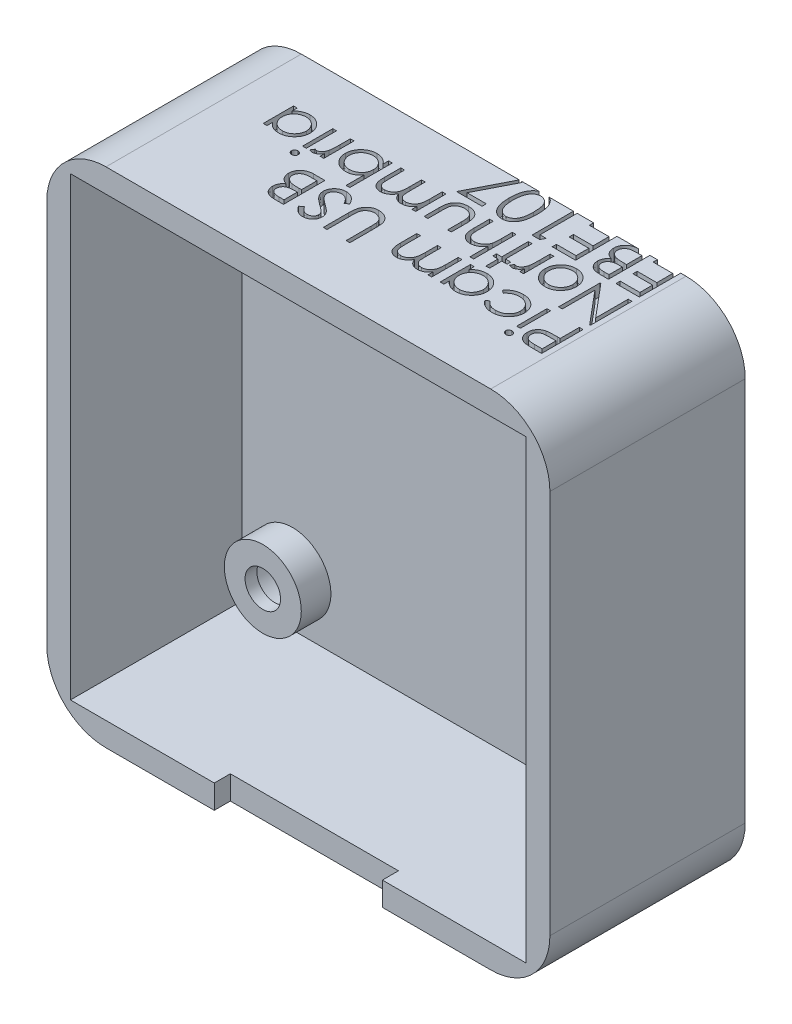
from build123d import *

# Parameters (mm, degrees)
SKETCH1_W           = 40.5
SKETCH1_H           = 40.5
BOSS_EXTRUDE1_DEPTH = 2
SKETCH2_R           = 1.25
CUT_EXTRUDE1_DEPTH  = 2
SKETCH3_W           = 42.5
SKETCH3_H           = 42.5
SKETCH3_W_2         = 40.5
SKETCH3_H_2         = 40.5
BOSS_EXTRUDE2_DEPTH = 2
SKETCH4_W           = 42.5
SKETCH4_H           = 42.5
SKETCH4_W_2         = 38.5
SKETCH4_H_2         = 38.5
BOSS_EXTRUDE3_DEPTH = 14.5
SKETCH6_R           = 3.25
SKETCH6_R_2         = 2.25
BOSS_EXTRUDE4_DEPTH = 2.5
BOSS_EXTRUDE5_START = -2
SKETCH7_R           = 1.25
BOSS_EXTRUDE5_DEPTH = 2
SKETCH8_R           = 1.25
CUT_EXTRUDE2_DEPTH  = 2
SKETCH10_R          = 2.25
SKETCH10_R_2        = 1.25
BOSS_EXTRUDE6_DEPTH = 1
SKETCH11_R          = 2.25
CUT_EXTRUDE3_DEPTH  = 3.5
SKETCH12_W          = 7.5
SKETCH12_H          = 3.5
CUT_EXTRUDE4_DEPTH  = 3.5
SKETCH13_W          = 8
SKETCH13_H          = 4
CUT_EXTRUDE5_DEPTH  = 3.5
SKETCH14_R          = 1.5
CUT_EXTRUDE6_DEPTH  = 3.5
SKETCH15_R          = 1.5
CUT_EXTRUDE7_DEPTH  = 12
SKETCH16_R          = 2.5
CUT_EXTRUDE10_DEPTH = 3.5
SKETCH17_W          = 14.2
SKETCH17_H          = 2.712559322
CUT_EXTRUDE11_DEPTH = 3.5
FILLET1_R           = 5
SKETCH18_W          = 0.314102564
SKETCH18_H          = 2.557692308
SKETCH18_W_2        = 0.314102565
CUT_EXTRUDE13_DEPTH = 1


with BuildPart() as part:
    # Sketch1 → Boss-Extrude1 (new body)
    with BuildSketch(Plane.XY):
        Rectangle(SKETCH1_W, SKETCH1_H)
    extrude(amount=BOSS_EXTRUDE1_DEPTH)

    # Sketch2 → Cut-Extrude1 (cut)
    with BuildSketch(Plane.XY.offset(2)):
        with Locations((-15, 15)):
            Circle(SKETCH2_R)
        with Locations((15, -15)):
            Circle(SKETCH2_R)
        with Locations((15, 16.25)):
            Circle(SKETCH2_R)
        with Locations((-15, -15)):
            Circle(SKETCH2_R)
    extrude(amount=-CUT_EXTRUDE1_DEPTH, mode=Mode.SUBTRACT)

    # Sketch3 → Boss-Extrude2 (add)
    with BuildSketch(Plane.XY.offset(2)):
        Rectangle(SKETCH3_W, SKETCH3_H)
        Rectangle(SKETCH3_W_2, SKETCH3_H_2, mode=Mode.SUBTRACT)
    extrude(amount=-BOSS_EXTRUDE2_DEPTH)

    # Sketch4 → Boss-Extrude3 (add)
    with BuildSketch(Plane.XY.offset(2)):
        Rectangle(SKETCH4_W, SKETCH4_H)
        Rectangle(SKETCH4_W_2, SKETCH4_H_2, mode=Mode.SUBTRACT)
    extrude(amount=BOSS_EXTRUDE3_DEPTH)

    # Sketch6 → Boss-Extrude4 (add)
    # profile 1 of 4: a face of its own
    with BuildSketch(Plane.XY.offset(2)):
        with Locations((-15, 15)):
            Circle(SKETCH6_R)
        with Locations((-15, 15)):
            Circle(SKETCH6_R_2, mode=Mode.SUBTRACT)
    # profile 2 of 4: a face of its own
    with BuildSketch(Plane.XY.offset(2)):
        with Locations((15, 15)):
            Circle(SKETCH6_R)
        with Locations((15, 15)):
            Circle(SKETCH6_R_2, mode=Mode.SUBTRACT)
    # profile 3 of 4: a face of its own
    with BuildSketch(Plane.XY.offset(2)):
        with Locations((-15, -15)):
            Circle(SKETCH6_R)
        with Locations((-15, -15)):
            Circle(SKETCH6_R_2, mode=Mode.SUBTRACT)
    # profile 4 of 4: a face of its own
    with BuildSketch(Plane.XY.offset(2)):
        with Locations((15, -15)):
            Circle(SKETCH6_R)
        with Locations((15, -15)):
            Circle(SKETCH6_R_2, mode=Mode.SUBTRACT)
    extrude(amount=BOSS_EXTRUDE4_DEPTH)

    # Sketch7 → Boss-Extrude5 (add)
    with BuildSketch(Plane(origin=(0, 0, 0), x_dir=(-1, 0, 0), z_dir=(0, 0, -1)).offset(BOSS_EXTRUDE5_START)):
        with Locations((-15, 16.25)):
            Circle(SKETCH7_R)
    extrude(amount=BOSS_EXTRUDE5_DEPTH)

    # Sketch8 → Cut-Extrude2 (cut)
    with BuildSketch(Plane.XY.offset(2)):
        with Locations((15, 15)):
            Circle(SKETCH8_R)
    extrude(amount=-CUT_EXTRUDE2_DEPTH, mode=Mode.SUBTRACT)

    # Sketch10 → Boss-Extrude6 (add)
    # profile 1 of 4: a face of its own
    with BuildSketch(Plane.XY.offset(4.5)):
        with Locations((-15, 15)):
            Circle(SKETCH10_R)
        with Locations((-15, 15)):
            Circle(SKETCH10_R_2, mode=Mode.SUBTRACT)
    # profile 2 of 4: a face of its own
    with BuildSketch(Plane.XY.offset(4.5)):
        with Locations((15, 15)):
            Circle(SKETCH10_R)
        with Locations((15, 15)):
            Circle(SKETCH10_R_2, mode=Mode.SUBTRACT)
    # profile 3 of 4: a face of its own
    with BuildSketch(Plane.XY.offset(4.5)):
        with Locations((-15, -15)):
            Circle(SKETCH10_R)
        with Locations((-15, -15)):
            Circle(SKETCH10_R_2, mode=Mode.SUBTRACT)
    # profile 4 of 4: a face of its own
    with BuildSketch(Plane.XY.offset(4.5)):
        with Locations((15, -15)):
            Circle(SKETCH10_R)
        with Locations((15, -15)):
            Circle(SKETCH10_R_2, mode=Mode.SUBTRACT)
    extrude(amount=-BOSS_EXTRUDE6_DEPTH)

    # Sketch11 → Cut-Extrude3 (cut)
    with BuildSketch(Plane(origin=(0, 0, 0), x_dir=(-1, 0, 0), z_dir=(0, 0, -1))):
        with Locations((-15, 15)):
            Circle(SKETCH11_R)
        with Locations((15, 15)):
            Circle(SKETCH11_R)
        with Locations((15, -15)):
            Circle(SKETCH11_R)
        with Locations((-15, -15)):
            Circle(SKETCH11_R)
    extrude(amount=-CUT_EXTRUDE3_DEPTH, mode=Mode.SUBTRACT)

    # Sketch12 → Cut-Extrude4 (cut)
    with BuildSketch(Plane(origin=(0, 0, 0), x_dir=(-1, 0, 0), z_dir=(0, 0, -1))):
        with Locations((-7.05, 13.45)):
            Rectangle(SKETCH12_W, SKETCH12_H)
    extrude(amount=-CUT_EXTRUDE4_DEPTH, mode=Mode.SUBTRACT)

    # Sketch13 → Cut-Extrude5 (cut)
    with BuildSketch(Plane(origin=(0, 0, 0), x_dir=(-1, 0, 0), z_dir=(0, 0, -1))):
        with Locations((-7.05, 13.45)):
            Rectangle(SKETCH13_W, SKETCH13_H)
    extrude(amount=-CUT_EXTRUDE5_DEPTH, mode=Mode.SUBTRACT)

    # Sketch14 → Cut-Extrude6 (cut)
    with BuildSketch(Plane(origin=(0, 0, 0), x_dir=(-1, 0, 0), z_dir=(0, 0, -1))):
        with Locations((14, 7)):
            Circle(SKETCH14_R)
    extrude(amount=-CUT_EXTRUDE6_DEPTH, mode=Mode.SUBTRACT)

    # Sketch15 → Cut-Extrude7 (cut)
    with BuildSketch(Plane(origin=(0, 0, 0), x_dir=(-1, 0, 0), z_dir=(0, 0, -1))):
        with Locations((-15, 15)):
            Circle(SKETCH15_R)
        with Locations((15, 15)):
            Circle(SKETCH15_R)
        with Locations((-15, -15)):
            Circle(SKETCH15_R)
        with Locations((15, -15)):
            Circle(SKETCH15_R)
    extrude(amount=-CUT_EXTRUDE7_DEPTH, mode=Mode.SUBTRACT)

    # Sketch16 → Cut-Extrude10 (cut)
    with BuildSketch(Plane(origin=(0, 0, 0), x_dir=(-1, 0, 0), z_dir=(0, 0, -1))):
        with Locations((-15, 15)):
            Circle(SKETCH16_R)
        with Locations((15, 15)):
            Circle(SKETCH16_R)
        with Locations((-15, -15)):
            Circle(SKETCH16_R)
        with Locations((15, -15)):
            Circle(SKETCH16_R)
    extrude(amount=-CUT_EXTRUDE10_DEPTH, mode=Mode.SUBTRACT)

    # Sketch17 → Cut-Extrude11 (cut)
    with BuildSketch(Plane.XZ.offset(21.25)):
        with Locations((0, 16.5)):
            Rectangle(SKETCH17_W, SKETCH17_H)
    extrude(amount=-CUT_EXTRUDE11_DEPTH, mode=Mode.SUBTRACT)

    # Fillet1
    fillet1_edges = [part.edges().sort_by_distance(p)[0] for p in [
        (-21.25, -21.25, 8.25),
        (-21.25, 21.25, 8.25),
        (21.25, 21.25, 8.25),
        (21.25, -21.25, 8.25),
    ]]
    fillet(fillet1_edges, radius=FILLET1_R)

    # Sketch18 → Cut-Extrude13 (cut)
    # profile 1 of 27: a face of its own
    with BuildSketch(Plane(origin=(0, 21.25, 0), x_dir=(1, 0, 0), z_dir=(0, 1, 0))):
        with BuildLine():
            Line((15.801282051, -11.75), (15.114883814, -11.75))
            add(Edge.make_bspline(
                [(15.114883814, -11.75), (15.067672908, -11.749948104), (14.977214715, -11.749848668), (14.847499659, -11.746833922), (14.729689928, -11.74280723), (14.624039547, -11.737225337), (14.530223449, -11.730628747), (14.448666149, -11.721376708), (14.378726593, -11.711716412), (14.336820143, -11.701895005), (14.317708333, -11.697415865)],
                knots=[0, 0, 0, 0, 1.415646017, 2.712440637, 3.8905458, 4.950247383, 5.884950622, 6.709939814, 7.411656543, 8, 8, 8, 8], degree=3))
            add(Edge.make_bspline(
                [(14.317708333, -11.697415865), (14.293514953, -11.690793716), (14.24569828, -11.677705459), (14.176795013, -11.651494627), (14.111249424, -11.62040173), (14.048787341, -11.585017464), (13.990478811, -11.543670818), (13.93450333, -11.498748179), (13.882034784, -11.448432769), (13.833865431, -11.392790834), (13.789234446, -11.333645181), (13.751875112, -11.269487627), (13.718885351, -11.202543825), (13.693176129, -11.13117932), (13.672967693, -11.056336115), (13.658249867, -10.977819417), (13.648790407, -10.895798604), (13.647892823, -10.839736808), (13.647435897, -10.811197917)],
                knots=[0, 0, 0, 0, 0.999333726, 1.975119402, 2.933498163, 3.889020618, 4.832249799, 5.779334906, 6.747801194, 7.724875447, 8.710438469, 9.696133548, 10.679360639, 11.681339199, 12.714023775, 13.766351759, 14.862936069, 16, 16, 16, 16], degree=3))
            add(Edge.make_bspline(
                [(13.647435897, -10.811197917), (13.647857322, -10.78242014), (13.648681868, -10.726114476), (13.658578153, -10.643741688), (13.671908345, -10.565023298), (13.692405397, -10.490133847), (13.71925107, -10.419518077), (13.750743123, -10.352096845), (13.788726654, -10.289017173), (13.832371483, -10.230050055), (13.880923078, -10.175140143), (13.934176016, -10.124685348), (13.991915308, -10.07898101), (14.053957457, -10.037924666), (14.120907305, -10.002468387), (14.191749459, -9.970711082), (14.267099675, -9.944040021), (14.319242189, -9.93000996), (14.345753205, -9.922876603)],
                knots=[0, 0, 0, 0, 1.121902311, 2.195077645, 3.232258892, 4.234102512, 5.217864754, 6.176164875, 7.132989551, 8.084763148, 9.034132444, 9.988522005, 10.94243251, 11.903244335, 12.886203696, 13.894208494, 14.929344452, 16, 16, 16, 16], degree=3))
            add(Edge.make_bspline(
                [(14.345753205, -9.922876603), (14.367680789, -9.918217097), (14.415736363, -9.908005519), (14.494874123, -9.896527991), (14.587060745, -9.887115164), (14.691982571, -9.878331038), (14.809884274, -9.87367655), (14.940495445, -9.868211422), (15.084258116, -9.865632726), (15.184528097, -9.865469721), (15.236879006, -9.865384615)],
                knots=[0, 0, 0, 0, 0.601372724, 1.317943291, 2.144091499, 3.08771165, 4.142394186, 5.309582461, 6.595334295, 8, 8, 8, 8], degree=3))
            Line((15.236879006, -9.865384615), (15.487179487, -9.865384615))
            Line((15.487179487, -9.865384615), (15.487179487, -8.25))
            Line((15.487179487, -8.25), (15.801282051, -8.25))
            Line((15.801282051, -8.25), (15.801282051, -11.75))
        make_face()
        with BuildLine():
            Line((15.487179487, -11.391025641), (15.487179487, -10.224358974))
            Line((15.487179487, -10.224358974), (14.874399038, -10.216646635))
            add(Edge.make_bspline(
                [(14.874399038, -10.216646635), (14.844478609, -10.216626906), (14.786717837, -10.21658882), (14.703055338, -10.220642381), (14.625622707, -10.225052198), (14.554305618, -10.232183919), (14.489429582, -10.240882396), (14.430837525, -10.252512303), (14.378061854, -10.264374057), (14.317270126, -10.284956306), (14.249177014, -10.31600724), (14.175271874, -10.362385681), (14.112125993, -10.420810855), (14.057943793, -10.487211671), (14.015116465, -10.561157594), (13.984077644, -10.640055756), (13.965132192, -10.723606571), (13.962750909, -10.780717315), (13.961538462, -10.809795673)],
                knots=[0, 0, 0, 0, 1.160501667, 2.240324542, 3.248665471, 4.168823117, 5.020172044, 5.786515869, 6.485785279, 7.116517804, 8.272762037, 9.381837012, 10.485674779, 11.594342068, 12.695271952, 13.786226926, 14.872841088, 16, 16, 16, 16], degree=3))
            add(Edge.make_bspline(
                [(13.961538462, -10.809795673), (13.962805001, -10.837931972), (13.965322726, -10.893863453), (13.983921148, -10.975874881), (14.015445176, -11.053876095), (14.057978708, -11.127235926), (14.110862512, -11.193460259), (14.172752553, -11.25058335), (14.242685917, -11.296817803), (14.307231506, -11.327595638), (14.364994726, -11.345644446), (14.414925775, -11.358674771), (14.471589878, -11.36766151), (14.53445078, -11.376260128), (14.603428, -11.383201084), (14.678960146, -11.388021106), (14.760795626, -11.390812422), (14.817605931, -11.390952847), (14.847055288, -11.391025641)],
                knots=[0, 0, 0, 0, 1.12039168, 2.227199994, 3.330242575, 4.460839274, 5.593542475, 6.693949254, 7.801736126, 8.92216649, 9.528704869, 10.210659466, 10.975987387, 11.81211542, 12.738540127, 13.736887663, 14.826846554, 16, 16, 16, 16], degree=3))
            Line((14.847055288, -11.391025641), (15.487179487, -11.391025641))
        make_face(mode=Mode.SUBTRACT)
    # profile 2 of 27: a face of its own
    with BuildSketch(Plane(origin=(0, 21.25, 0), x_dir=(1, 0, 0), z_dir=(0, 1, 0))):
        with BuildLine():
            add(Edge.make_bspline(
                [(12.908453526, -11.884615385), (12.888965464, -11.88370731), (12.850804097, -11.881929126), (12.795564604, -11.866823357), (12.745315807, -11.840827583), (12.700081216, -11.807084436), (12.662583819, -11.765769317), (12.63569619, -11.71882621), (12.61853121, -11.66772133), (12.616446197, -11.632112539), (12.615384615, -11.613982372)],
                knots=[0, 0, 0, 0, 1.054986045, 2.065865298, 3.074122704, 4.105114675, 5.109626121, 6.074217918, 7.019490725, 8, 8, 8, 8], degree=3))
            add(Edge.make_bspline(
                [(12.615384615, -11.613982372), (12.616469945, -11.596322808), (12.618615514, -11.561411939), (12.635683501, -11.511193153), (12.66280924, -11.464903719), (12.700056258, -11.423669374), (12.745322399, -11.38994572), (12.79556286, -11.363944797), (12.850804556, -11.348840388), (12.888965619, -11.347062016), (12.908453526, -11.346153846)],
                knots=[0, 0, 0, 0, 0.961106377, 1.899993565, 2.859409042, 3.870007927, 4.90724781, 5.921615355, 6.938620636, 8, 8, 8, 8], degree=3))
            add(Edge.make_bspline(
                [(12.908453526, -11.346153846), (12.927717609, -11.347032849), (12.96521263, -11.348743713), (13.019436432, -11.364125508), (13.068876707, -11.389889179), (13.113371543, -11.424136064), (13.151357036, -11.464629537), (13.178382689, -11.511228119), (13.195496311, -11.561403037), (13.19763573, -11.596319817), (13.198717949, -11.613982372)],
                knots=[0, 0, 0, 0, 1.055304112, 2.054011575, 3.063363921, 4.096942562, 5.122536081, 6.088009498, 7.032825006, 8, 8, 8, 8], degree=3))
            add(Edge.make_bspline(
                [(13.198717949, -11.613982372), (13.197659594, -11.632115643), (13.195580918, -11.667730531), (13.178369406, -11.718790647), (13.151585238, -11.766045838), (13.113346999, -11.806618084), (13.068883132, -11.840884), (13.019434758, -11.866642695), (12.965213074, -11.88202579), (12.92771776, -11.883736474), (12.908453526, -11.884615385)],
                knots=[0, 0, 0, 0, 0.986662878, 1.937868148, 2.908513651, 3.927890639, 4.955204348, 5.958438607, 6.951092507, 8, 8, 8, 8], degree=3))
        make_face()
    # profile 3 of 27: a face of its own
    with BuildSketch(Plane(origin=(0, 21.25, 0), x_dir=(1, 0, 0), z_dir=(0, 1, 0))):
        with Locations((12.907051282, -9.528846154)):
            Rectangle(SKETCH18_W, SKETCH18_H)
    # profile 4 of 27: a face of its own
    with BuildSketch(Plane(origin=(0, 21.25, 0), x_dir=(1, 0, 0), z_dir=(0, 1, 0))):
        with BuildLine():
            Line((9.519230769, -10.253104968), (9.782151442, -10.08974359))
            add(Edge.make_bspline(
                [(9.782151442, -10.08974359), (9.810979699, -10.125575019), (9.867723227, -10.196103104), (9.966285434, -10.287069702), (10.071376334, -10.365517794), (10.184977407, -10.428593404), (10.306093325, -10.478385102), (10.434973612, -10.512989677), (10.571578499, -10.534740583), (10.66524658, -10.537200898), (10.713241186, -10.538461538)],
                knots=[0, 0, 0, 0, 1.026629843, 2.020746545, 2.988156479, 3.951609825, 4.916760838, 5.907688704, 6.927920211, 8, 8, 8, 8], degree=3))
            add(Edge.make_bspline(
                [(10.713241186, -10.538461538), (10.751600098, -10.537404632), (10.827146931, -10.535323084), (10.93805373, -10.522313503), (11.043693747, -10.498668193), (11.144742892, -10.467529159), (11.240432345, -10.425735107), (11.331030184, -10.375181733), (11.416839434, -10.315653632), (11.496496939, -10.247579651), (11.569092764, -10.172809808), (11.633297708, -10.093849662), (11.686885274, -10.010146373), (11.731554792, -9.923288589), (11.765163323, -9.831782059), (11.78987821, -9.736738455), (11.804942931, -9.637532367), (11.806768236, -9.570030561), (11.807692308, -9.535857372)],
                knots=[0, 0, 0, 0, 1.11253269, 2.191102883, 3.232049486, 4.248096668, 5.252846381, 6.25411548, 7.252444123, 8.276484619, 9.287796331, 10.271127345, 11.222403915, 12.165070373, 13.097940083, 14.043161362, 15.009338842, 16, 16, 16, 16], degree=3))
            add(Edge.make_bspline(
                [(11.807692308, -9.535857372), (11.805890111, -9.491092598), (11.802300779, -9.401937144), (11.774880488, -9.270590497), (11.729291775, -9.143593608), (11.66649382, -9.022428577), (11.588073066, -8.909948199), (11.496607893, -8.808232341), (11.390021975, -8.72153142), (11.271456139, -8.648968686), (11.143047828, -8.590401185), (11.005815887, -8.549073633), (10.860928702, -8.523989065), (10.761720209, -8.520837583), (10.711137821, -8.519230769)],
                knots=[0, 0, 0, 0, 0.966432114, 1.924787868, 2.884432441, 3.8733594, 4.863432433, 5.839037063, 6.818291847, 7.820033371, 8.83442759, 9.858062464, 10.907912868, 12, 12, 12, 12], degree=3))
            add(Edge.make_bspline(
                [(10.711137821, -8.519230769), (10.664782636, -8.520530266), (10.573682398, -8.523084123), (10.440515113, -8.544613087), (10.313735202, -8.57985672), (10.193347171, -8.62900437), (10.079571005, -8.692531886), (9.97314183, -8.770891057), (9.871941892, -8.861827657), (9.812444915, -8.932145629), (9.782151442, -8.967948718)],
                knots=[0, 0, 0, 0, 1.039848629, 2.043578496, 3.018386758, 3.987534228, 4.954977003, 5.934852016, 6.948509513, 8, 8, 8, 8], degree=3))
            Line((9.782151442, -8.967948718), (9.519230769, -8.795472756))
            add(Edge.make_bspline(
                [(9.519230769, -8.795472756), (9.534818605, -8.772582216), (9.565942538, -8.726877113), (9.617968175, -8.662430209), (9.674095505, -8.602119037), (9.734060746, -8.545961602), (9.797102879, -8.492972846), (9.864862865, -8.444654445), (9.936187157, -8.399783722), (10.011402989, -8.359120817), (10.089769603, -8.322649661), (10.171289389, -8.291087304), (10.255594097, -8.264401405), (10.342494287, -8.242808188), (10.432127093, -8.225725389), (10.524424257, -8.214363913), (10.61936851, -8.205890744), (10.68354057, -8.205384589), (10.716045673, -8.205128205)],
                knots=[0, 0, 0, 0, 0.954067324, 1.904967979, 2.850944488, 3.791040077, 4.734579251, 5.686741025, 6.656553487, 7.63677735, 8.631289747, 9.633371755, 10.647134148, 11.676547777, 12.717490898, 13.789379914, 14.88025357, 16, 16, 16, 16], degree=3))
            add(Edge.make_bspline(
                [(10.716045673, -8.205128205), (10.765655908, -8.206020966), (10.862892327, -8.207770783), (11.005223994, -8.226958367), (11.141204401, -8.255991847), (11.271072573, -8.297309333), (11.394034324, -8.351873903), (11.511114144, -8.416998341), (11.621100747, -8.494836298), (11.723284819, -8.583533069), (11.816698386, -8.679815619), (11.898102866, -8.78305293), (11.966716494, -8.891320838), (12.024752901, -9.004171334), (12.067821066, -9.123089664), (12.098711235, -9.246913072), (12.118331158, -9.375610906), (12.120629617, -9.463337529), (12.121794872, -9.5078125)],
                knots=[0, 0, 0, 0, 1.113059169, 2.18160405, 3.217886321, 4.231664885, 5.234757072, 6.233049254, 7.234521092, 8.253729116, 9.266692789, 10.241774134, 11.199466202, 12.140354715, 13.084805663, 14.031527209, 15.002038753, 16, 16, 16, 16], degree=3))
            add(Edge.make_bspline(
                [(12.121794872, -9.5078125), (12.121327026, -9.537986107), (12.120396402, -9.598006391), (12.110726231, -9.687210332), (12.096242569, -9.774834339), (12.075680519, -9.860752657), (12.049878502, -9.945225183), (12.017450323, -10.027800789), (11.979500139, -10.108959941), (11.935347887, -10.187703339), (11.886645053, -10.263554146), (11.833721528, -10.336080502), (11.77566732, -10.403424895), (11.713710583, -10.467272774), (11.646912664, -10.52571789), (11.576517983, -10.58128528), (11.500789409, -10.63109605), (11.421656991, -10.677609275), (11.339018489, -10.718951856), (11.253455531, -10.754589631), (11.165461504, -10.785040988), (11.074901631, -10.809150238), (10.982375384, -10.829367572), (10.887154066, -10.842085442), (10.789601838, -10.851071709), (10.723545816, -10.852062502), (10.690104167, -10.852564103)],
                knots=[0, 0, 0, 0, 0.991083503, 1.971428668, 2.944771278, 3.907728914, 4.872032831, 5.84458753, 6.820199395, 7.813689706, 8.808455339, 9.780676499, 10.761021664, 11.727616056, 12.70141294, 13.675300653, 14.672050164, 15.67696011, 16.690052069, 17.705469636, 18.720567748, 19.746988726, 20.783187267, 21.830086354, 22.901455311, 24, 24, 24, 24], degree=3))
            add(Edge.make_bspline(
                [(10.690104167, -10.852564103), (10.648223889, -10.851642552), (10.564672672, -10.849804056), (10.440734478, -10.834320351), (10.318609835, -10.811002937), (10.200497805, -10.776359579), (10.087824971, -10.734823059), (9.982832462, -10.686999012), (9.886286436, -10.633963732), (9.798214662, -10.573908), (9.718464584, -10.505839077), (9.644953755, -10.43009282), (9.57716339, -10.346188166), (9.538701014, -10.28438877), (9.519230769, -10.253104968)],
                knots=[0, 0, 0, 0, 1.09515944, 2.184844758, 3.26271859, 4.344330843, 5.400469667, 6.401765382, 7.359563569, 8.278649927, 9.185124711, 10.097353643, 11.036851215, 12, 12, 12, 12], degree=3))
        make_face()
    # profile 5 of 27: a face of its own
    with BuildSketch(Plane(origin=(0, 21.25, 0), x_dir=(1, 0, 0), z_dir=(0, 1, 0))):
        with BuildLine():
            Line((6.288461538, -10.807692308), (6.288461538, -8.25))
            Line((6.288461538, -8.25), (6.602564103, -8.25))
            Line((6.602564103, -8.25), (6.602564103, -8.692407853))
            add(Edge.make_bspline(
                [(6.602564103, -8.692407853), (6.638030878, -8.652423465), (6.707347664, -8.574277391), (6.822010759, -8.471556239), (6.944557699, -8.387689474), (7.072900667, -8.319614657), (7.208033083, -8.268298572), (7.349161319, -8.232147026), (7.496174953, -8.208629931), (7.596430284, -8.206305919), (7.647235577, -8.205128205)],
                knots=[0, 0, 0, 0, 1.074235403, 2.099501444, 3.086304576, 4.053325556, 5.01427503, 5.985443889, 6.979105517, 8, 8, 8, 8], degree=3))
            add(Edge.make_bspline(
                [(7.647235577, -8.205128205), (7.692403654, -8.206354374), (7.7814771, -8.208772433), (7.912504413, -8.227537663), (8.038603179, -8.257657479), (8.159853765, -8.299598139), (8.275434599, -8.35494392), (8.385996947, -8.421919959), (8.491798843, -8.50089654), (8.590828156, -8.591535176), (8.682135637, -8.689877501), (8.76202046, -8.795073941), (8.829725449, -8.905679624), (8.885366824, -9.021663464), (8.928425037, -9.142940677), (8.958381903, -9.269428064), (8.977126911, -9.400915158), (8.979543745, -9.490455063), (8.980769231, -9.535857372)],
                knots=[0, 0, 0, 0, 1.034036272, 2.039165313, 3.024406509, 3.999331371, 4.971254918, 5.953351348, 6.95522652, 7.989525907, 9.023492927, 10.024309745, 11.009187477, 11.988246066, 12.964946762, 13.950187958, 14.960617622, 16, 16, 16, 16], degree=3))
            add(Edge.make_bspline(
                [(8.980769231, -9.535857372), (8.979516565, -9.580321265), (8.977040111, -9.668223983), (8.958582481, -9.797499942), (8.927567755, -9.922028314), (8.883959586, -10.041347799), (8.828288623, -10.155938937), (8.759419261, -10.264905164), (8.679563225, -10.369913357), (8.587279898, -10.46759609), (8.487361761, -10.557499363), (8.380967914, -10.636667873), (8.269424981, -10.703472192), (8.152509305, -10.757777609), (8.031048751, -10.800931998), (7.904120647, -10.831014763), (7.772302213, -10.848698613), (7.682812661, -10.851263226), (7.637419872, -10.852564103)],
                knots=[0, 0, 0, 0, 1.02050356, 2.017480486, 2.990790918, 3.96161403, 4.928589988, 5.909588639, 6.91611943, 7.952353252, 8.989586576, 9.99823133, 10.991940466, 11.968822692, 12.952985106, 13.945868367, 14.958059758, 16, 16, 16, 16], degree=3))
            add(Edge.make_bspline(
                [(7.637419872, -10.852564103), (7.585218971, -10.851131749), (7.482855469, -10.848322972), (7.33291906, -10.824748841), (7.19101219, -10.785290762), (7.055905725, -10.731434549), (6.929498348, -10.658909397), (6.810574854, -10.569171434), (6.700546311, -10.460045118), (6.635789826, -10.377029398), (6.602564103, -10.334435096)],
                knots=[0, 0, 0, 0, 1.038908319, 2.037250181, 3.012632028, 3.966567879, 4.9252131, 5.905168122, 6.925168603, 8, 8, 8, 8], degree=3))
            Line((6.602564103, -10.334435096), (6.602564103, -10.807692308))
            Line((6.602564103, -10.807692308), (6.288461538, -10.807692308))
        make_face()
        with BuildLine():
            add(Edge.make_bspline(
                [(7.633213141, -10.538461538), (7.679126518, -10.53682652), (7.769752223, -10.533599254), (7.902810115, -10.508445723), (8.030071334, -10.466486109), (8.15132893, -10.409432177), (8.2632352, -10.336347851), (8.36490725, -10.250175763), (8.453588925, -10.149860141), (8.528571776, -10.037705752), (8.590821439, -9.918191626), (8.633778542, -9.792346872), (8.662310844, -9.66357282), (8.665210945, -9.576206005), (8.666666667, -9.532351763)],
                knots=[0, 0, 0, 0, 1.031179624, 2.035384561, 3.030098214, 4.035455833, 5.037557836, 6.024646278, 7.02156144, 8.035264006, 9.049836703, 10.039645228, 11.015989397, 12, 12, 12, 12], degree=3))
            add(Edge.make_bspline(
                [(8.666666667, -9.532351763), (8.664776961, -9.488770317), (8.661004956, -9.401778249), (8.634655096, -9.272806855), (8.588403455, -9.14778314), (8.527515476, -9.02672842), (8.451352298, -8.913737481), (8.362845655, -8.811569584), (8.260657701, -8.724069157), (8.147766028, -8.650778262), (8.027319631, -8.591821626), (7.900610927, -8.550239324), (7.769848407, -8.523984622), (7.680777945, -8.520820717), (7.636017628, -8.519230769)],
                knots=[0, 0, 0, 0, 0.979235476, 1.954632679, 2.943119654, 3.967171814, 4.992637064, 5.997548408, 6.995574264, 8.005058949, 9.015076297, 9.999929117, 10.994910263, 12, 12, 12, 12], degree=3))
            add(Edge.make_bspline(
                [(7.636017628, -8.519230769), (7.590571849, -8.520884944), (7.500414582, -8.524166566), (7.366896613, -8.549493568), (7.23756423, -8.59197419), (7.113470697, -8.64982025), (6.998063459, -8.721535295), (6.894965711, -8.805865773), (6.805899172, -8.902439933), (6.732567556, -9.010680718), (6.673976586, -9.128036115), (6.632489734, -9.253383073), (6.607292082, -9.385976737), (6.604161887, -9.476851065), (6.602564103, -9.523237179)],
                knots=[0, 0, 0, 0, 1.017730373, 2.019016736, 3.032373701, 4.060729657, 5.079187105, 6.068726676, 7.03591854, 8.011858086, 8.988317194, 9.965225429, 10.961364673, 12, 12, 12, 12], degree=3))
            add(Edge.make_bspline(
                [(6.602564103, -9.523237179), (6.603523774, -9.558574996), (6.605412711, -9.628131003), (6.619843064, -9.730258715), (6.642798784, -9.827991728), (6.675142067, -9.921437013), (6.717644087, -10.010062376), (6.768851392, -10.094562515), (6.82981432, -10.174150324), (6.898677613, -10.248725013), (6.974904644, -10.316404356), (7.055962211, -10.376056362), (7.141646376, -10.426538373), (7.231896993, -10.466937187), (7.326018944, -10.499849087), (7.424914372, -10.521586828), (7.527586591, -10.536560777), (7.597633579, -10.53782128), (7.633213141, -10.538461538)],
                knots=[0, 0, 0, 0, 1.050062701, 2.066855696, 3.059271411, 4.030305351, 4.999747758, 5.975466543, 6.961907836, 7.974539719, 8.98812422, 9.98710676, 10.961662635, 11.93785114, 12.922015094, 13.919620009, 14.94329489, 16, 16, 16, 16], degree=3))
        make_face(mode=Mode.SUBTRACT)
    # profile 6 of 27: a face of its own
    with BuildSketch(Plane(origin=(0, 21.25, 0), x_dir=(1, 0, 0), z_dir=(0, 1, 0))):
        with BuildLine():
            Line((5.570512821, -10.807692308), (5.256410256, -10.807692308))
            Line((5.256410256, -10.807692308), (5.256410256, -10.36318109))
            add(Edge.make_bspline(
                [(5.256410256, -10.36318109), (5.228064956, -10.402011156), (5.173844667, -10.476287224), (5.085786677, -10.575255602), (4.996303117, -10.657864562), (4.932314433, -10.70179792), (4.901642628, -10.722856571)],
                knots=[0, 0, 0, 0, 1.134266299, 2.169680534, 3.122669868, 4, 4, 4, 4], degree=3))
            add(Edge.make_bspline(
                [(4.901642628, -10.722856571), (4.859777966, -10.742861936), (4.776780066, -10.782523149), (4.645360841, -10.822756708), (4.510886172, -10.847481809), (4.420077958, -10.850863183), (4.374399038, -10.852564103)],
                knots=[0, 0, 0, 0, 1.014936303, 2.012140481, 3.000054389, 4, 4, 4, 4], degree=3))
            add(Edge.make_bspline(
                [(4.374399038, -10.852564103), (4.343507183, -10.851516021), (4.282373863, -10.849441925), (4.19177311, -10.836022623), (4.103765963, -10.812545993), (4.018917869, -10.780679393), (3.939477786, -10.740838066), (3.86645696, -10.695082054), (3.80113451, -10.643299473), (3.742536473, -10.584335802), (3.690312669, -10.514861696), (3.64260929, -10.433560154), (3.597945997, -10.339254854), (3.573347298, -10.270875827), (3.560396635, -10.234875801)],
                knots=[0, 0, 0, 0, 1.009705358, 1.998152609, 2.985684482, 3.981629544, 4.955207608, 5.885544107, 6.793375404, 7.673799057, 8.595028447, 9.626006337, 10.750145549, 12, 12, 12, 12], degree=3))
            add(Edge.make_bspline(
                [(3.560396635, -10.234875801), (3.546685132, -10.259599951), (3.519702822, -10.308253606), (3.474400768, -10.377115717), (3.426919882, -10.441508449), (3.376932326, -10.501565289), (3.324228043, -10.556807817), (3.269656662, -10.608364325), (3.211994444, -10.654802229), (3.132242901, -10.709156215), (3.028737076, -10.76685079), (2.897686139, -10.816252607), (2.761609093, -10.847060289), (2.668963654, -10.850720405), (2.622295673, -10.852564103)],
                knots=[0, 0, 0, 0, 0.861004964, 1.694336854, 2.508842991, 3.297356609, 4.072906766, 4.833509053, 5.582933055, 6.32546011, 7.772130661, 9.180397307, 10.579690848, 12, 12, 12, 12], degree=3))
            add(Edge.make_bspline(
                [(2.622295673, -10.852564103), (2.579406759, -10.850967141), (2.495468989, -10.847841733), (2.373476501, -10.822719073), (2.25921899, -10.781138774), (2.153907469, -10.722663924), (2.058765666, -10.649531394), (1.975750637, -10.562414829), (1.906687637, -10.461632405), (1.860517134, -10.367579812), (1.829780757, -10.284389392), (1.810584644, -10.213185215), (1.793953823, -10.134752788), (1.779853394, -10.049155195), (1.76965943, -9.956219128), (1.762081357, -9.855901886), (1.756959438, -9.748116296), (1.756597058, -9.673750864), (1.756410256, -9.635416667)],
                knots=[0, 0, 0, 0, 1.209392158, 2.366897878, 3.497663982, 4.628180075, 5.751982922, 6.871462727, 8.009245026, 9.185977379, 9.818124946, 10.509294143, 11.264649411, 12.079922034, 12.956003306, 13.901808055, 14.918415426, 16, 16, 16, 16], degree=3))
            Line((1.756410256, -9.635416667), (1.756410256, -8.25))
            Line((1.756410256, -8.25), (2.070512821, -8.25))
            Line((2.070512821, -8.25), (2.070512821, -9.63681891))
            add(Edge.make_bspline(
                [(2.070512821, -9.63681891), (2.070590325, -9.669539532), (2.070739278, -9.732423592), (2.073437881, -9.82267541), (2.078496779, -9.904945858), (2.084502891, -9.979342327), (2.092621434, -10.045841453), (2.103340421, -10.104257065), (2.114606015, -10.154855531), (2.133365968, -10.210926184), (2.163079652, -10.272724843), (2.209157526, -10.338898028), (2.266365767, -10.396904456), (2.332858371, -10.44756509), (2.408690647, -10.487954587), (2.491933015, -10.517882274), (2.582286196, -10.535575976), (2.644886217, -10.537483495), (2.676983173, -10.538461538)],
                knots=[0, 0, 0, 0, 1.25342297, 2.408888324, 3.45823814, 4.41064868, 5.267922422, 6.023041539, 6.685366708, 7.251591043, 8.284698338, 9.300514895, 10.326147092, 11.393333517, 12.490845139, 13.603767677, 14.771377999, 16, 16, 16, 16], degree=3))
            add(Edge.make_bspline(
                [(2.676983173, -10.538461538), (2.716612649, -10.536619905), (2.795093582, -10.532972794), (2.91013702, -10.506461221), (3.019220069, -10.461285365), (3.121937859, -10.400391487), (3.215674259, -10.325270848), (3.296626065, -10.236423687), (3.363444368, -10.135765955), (3.408700796, -10.042626069), (3.437292074, -9.958955941), (3.45615982, -9.885857545), (3.470924852, -9.802553656), (3.484504228, -9.710021108), (3.493668691, -9.607471972), (3.501764489, -9.495539461), (3.505601966, -9.373457335), (3.506134015, -9.28883038), (3.506410256, -9.244891827)],
                knots=[0, 0, 0, 0, 1.091115267, 2.160809405, 3.231897231, 4.331486719, 5.439373414, 6.528416898, 7.628213638, 8.756851852, 9.369612525, 10.061283877, 10.83397277, 11.69882403, 12.636571156, 13.668968181, 14.789721711, 16, 16, 16, 16], degree=3))
            Line((3.506410256, -9.244891827), (3.506410256, -8.25))
            Line((3.506410256, -8.25), (3.820512821, -8.25))
            Line((3.820512821, -8.25), (3.820512821, -9.550580929))
            add(Edge.make_bspline(
                [(3.820512821, -9.550580929), (3.820588693, -9.587274663), (3.820734663, -9.65786972), (3.823457842, -9.759097927), (3.828390516, -9.851196969), (3.834761448, -9.933935623), (3.841676143, -10.00753864), (3.852618636, -10.071764852), (3.864025636, -10.126880674), (3.881431602, -10.187916711), (3.911592978, -10.254111995), (3.957415496, -10.325279832), (4.014640303, -10.387886495), (4.081885337, -10.44179588), (4.15843136, -10.485479496), (4.242806994, -10.516313247), (4.333856195, -10.534955022), (4.396744453, -10.537270657), (4.429086538, -10.538461538)],
                knots=[0, 0, 0, 0, 1.320037001, 2.539618509, 3.642599628, 4.637590735, 5.525231343, 6.300657295, 6.980070891, 7.549441006, 8.580679949, 9.583455601, 10.583372174, 11.61806701, 12.672388285, 13.739107491, 14.837271374, 16, 16, 16, 16], degree=3))
            add(Edge.make_bspline(
                [(4.429086538, -10.538461538), (4.46710274, -10.536931073), (4.54286768, -10.533880911), (4.654169797, -10.506426711), (4.761654908, -10.463422348), (4.863611825, -10.403763649), (4.957277581, -10.329860333), (5.039316944, -10.242961138), (5.108022207, -10.144225095), (5.15407439, -10.052460756), (5.18356916, -9.970858567), (5.203002774, -9.901220201), (5.219649075, -9.82393758), (5.23360454, -9.739257242), (5.244137599, -9.646829475), (5.250431317, -9.546901601), (5.25596678, -9.43916219), (5.256258805, -9.364792141), (5.256410256, -9.326221955)],
                knots=[0, 0, 0, 0, 1.098782694, 2.18983489, 3.297678452, 4.440407233, 5.596094952, 6.739704233, 7.886210376, 9.065955464, 9.69932744, 10.395238925, 11.156791145, 11.986349475, 12.878233552, 13.847858808, 14.883845232, 16, 16, 16, 16], degree=3))
            Line((5.256410256, -9.326221955), (5.256410256, -8.25))
            Line((5.256410256, -8.25), (5.570512821, -8.25))
            Line((5.570512821, -8.25), (5.570512821, -10.807692308))
        make_face()
    # profile 7 of 27: a face of its own
    with BuildSketch(Plane(origin=(0, 21.25, 0), x_dir=(1, 0, 0), z_dir=(0, 1, 0))):
        with BuildLine():
            Line((-0.397435897, -11.75), (-0.711538462, -11.75))
            Line((-0.711538462, -11.75), (-0.711538462, -9.652944712))
            add(Edge.make_bspline(
                [(-0.711538462, -9.652944712), (-0.711491718, -9.623263976), (-0.711403013, -9.566939665), (-0.711995527, -9.486771364), (-0.713654895, -9.415498905), (-0.714701055, -9.352847558), (-0.717028388, -9.29910481), (-0.718926435, -9.2539795), (-0.721366992, -9.217685297), (-0.724300109, -9.196504371), (-0.725560897, -9.18739984)],
                knots=[0, 0, 0, 0, 1.528628734, 2.90083645, 4.128790002, 5.200304208, 6.127813768, 6.898992206, 7.526736466, 8, 8, 8, 8], degree=3))
            add(Edge.make_bspline(
                [(-0.725560897, -9.18739984), (-0.730674293, -9.154298323), (-0.740545474, -9.090397334), (-0.766866164, -8.999513967), (-0.801669043, -8.917170973), (-0.846022269, -8.842448337), (-0.900726273, -8.774820676), (-0.968220157, -8.7136378), (-1.048364615, -8.658723444), (-1.139337312, -8.610553793), (-1.236328748, -8.570602881), (-1.33578963, -8.540694638), (-1.435819994, -8.522394096), (-1.502797812, -8.520280393), (-1.536057692, -8.519230769)],
                knots=[0, 0, 0, 0, 1.042923073, 2.013316119, 2.939979093, 3.821796737, 4.712412725, 5.640305549, 6.650442997, 7.732186751, 8.842579391, 9.91407549, 10.964170509, 12, 12, 12, 12], degree=3))
            add(Edge.make_bspline(
                [(-1.536057692, -8.519230769), (-1.564613995, -8.520298608), (-1.621561666, -8.522428117), (-1.706129938, -8.535779086), (-1.788758571, -8.559361476), (-1.868780619, -8.5915024), (-1.944961964, -8.63096414), (-2.015254423, -8.678565725), (-2.078917748, -8.73320513), (-2.136330148, -8.794626379), (-2.186302384, -8.863205859), (-2.229320908, -8.938586266), (-2.26446932, -9.021368828), (-2.282126627, -9.079709301), (-2.291165865, -9.109575321)],
                knots=[0, 0, 0, 0, 0.994543961, 1.983343699, 2.972712664, 3.980751554, 4.981834161, 5.954730495, 6.930176574, 7.89761099, 8.875938748, 9.87834379, 10.913868493, 12, 12, 12, 12], degree=3))
            add(Edge.make_bspline(
                [(-2.291165865, -9.109575321), (-2.294165991, -9.121923895), (-2.300851479, -9.149441495), (-2.307098524, -9.195962785), (-2.313605049, -9.250852149), (-2.318119619, -9.314503962), (-2.32252084, -9.386704935), (-2.325153912, -9.467831192), (-2.326370945, -9.557588153), (-2.326733626, -9.620225315), (-2.326923077, -9.652944712)],
                knots=[0, 0, 0, 0, 0.558680831, 1.244966039, 2.062412453, 2.990489873, 4.051219941, 5.244515665, 6.560634259, 8, 8, 8, 8], degree=3))
            Line((-2.326923077, -9.652944712), (-2.326923077, -11.75))
            Line((-2.326923077, -11.75), (-2.641025641, -11.75))
            Line((-2.641025641, -11.75), (-2.641025641, -9.636117788))
            add(Edge.make_bspline(
                [(-2.641025641, -9.636117788), (-2.640774294, -9.598019006), (-2.640283776, -9.523666916), (-2.635944666, -9.41472116), (-2.629223796, -9.311348387), (-2.619071449, -9.213678635), (-2.607837964, -9.121601987), (-2.591901222, -9.035455695), (-2.574952942, -8.954508935), (-2.553683083, -8.878612401), (-2.528381399, -8.806620913), (-2.498250721, -8.737174695), (-2.461553269, -8.67089857), (-2.420014106, -8.606577576), (-2.372782753, -8.544804477), (-2.320261942, -8.485099922), (-2.261611054, -8.428248811), (-2.198308263, -8.373979348), (-2.130867522, -8.323151567), (-2.058532206, -8.27987588), (-1.982597135, -8.243251009), (-1.903867646, -8.212056677), (-1.821013094, -8.189245756), (-1.735065516, -8.172119682), (-1.64542087, -8.16243142), (-1.584456963, -8.16098756), (-1.553585737, -8.16025641)],
                knots=[0, 0, 0, 0, 1.316485072, 2.56920066, 3.767172097, 4.895413872, 5.962239305, 6.971350037, 7.921780903, 8.819233545, 9.69278517, 10.557066787, 11.431700348, 12.307563454, 13.200791052, 14.11626757, 15.05287325, 16.020813301, 16.99640464, 17.967304965, 18.928075993, 19.907403966, 20.889159767, 21.893313923, 22.933205135, 24, 24, 24, 24], degree=3))
            add(Edge.make_bspline(
                [(-1.553585737, -8.16025641), (-1.519916389, -8.161040632), (-1.453857247, -8.162579271), (-1.356522663, -8.171409724), (-1.263195774, -8.188000049), (-1.172965734, -8.20926136), (-1.086704267, -8.238105864), (-1.004436792, -8.273548065), (-0.925218708, -8.314010724), (-0.850834778, -8.361823734), (-0.780674809, -8.413960603), (-0.716915439, -8.471227237), (-0.657938131, -8.531442629), (-0.606342472, -8.596874192), (-0.560176945, -8.666182481), (-0.520458829, -8.739693486), (-0.486342355, -8.817308662), (-0.468736227, -8.871262289), (-0.459835737, -8.89853766)],
                knots=[0, 0, 0, 0, 1.138939089, 2.234594419, 3.301501784, 4.342532435, 5.367382236, 6.373123747, 7.370098489, 8.372230273, 9.360297234, 10.323289009, 11.268038109, 12.20748145, 13.137029304, 14.081414587, 15.030090602, 16, 16, 16, 16], degree=3))
            add(Edge.make_bspline(
                [(-0.459835737, -8.89853766), (-0.454658579, -8.917170235), (-0.443429208, -8.957584704), (-0.43140391, -9.024471192), (-0.421294828, -9.10148611), (-0.41178927, -9.188634728), (-0.406180312, -9.285984595), (-0.401262873, -9.393493511), (-0.397401255, -9.511291472), (-0.397424027, -9.593345988), (-0.397435897, -9.636117788)],
                knots=[0, 0, 0, 0, 0.625038921, 1.35572334, 2.194682327, 3.136881307, 4.189498639, 5.346923369, 6.617055217, 8, 8, 8, 8], degree=3))
            Line((-0.397435897, -9.636117788), (-0.397435897, -11.75))
        make_face()
    # profile 8 of 27: a face of its own
    with BuildSketch(Plane(origin=(0, 21.25, 0), x_dir=(1, 0, 0), z_dir=(0, 1, 0))):
        with BuildLine():
            Line((-3.224358974, -8.925180288), (-3.520232372, -9.102564103))
            add(Edge.make_bspline(
                [(-3.520232372, -9.102564103), (-3.547750609, -9.056499718), (-3.60047449, -8.968242134), (-3.688425849, -8.848984093), (-3.77955876, -8.747621937), (-3.874548094, -8.664745329), (-3.972814042, -8.599496442), (-4.074998095, -8.553294211), (-4.180755906, -8.524478235), (-4.252729728, -8.520978149), (-4.288661859, -8.519230769)],
                knots=[0, 0, 0, 0, 1.272034388, 2.437168799, 3.508375237, 4.49857839, 5.41946034, 6.295179144, 7.148887113, 8, 8, 8, 8], degree=3))
            add(Edge.make_bspline(
                [(-4.288661859, -8.519230769), (-4.31934251, -8.520105774), (-4.380166973, -8.521840472), (-4.469885826, -8.537835289), (-4.556585012, -8.564002692), (-4.639401635, -8.599475741), (-4.716145431, -8.643078758), (-4.784511035, -8.694498648), (-4.842275226, -8.753899214), (-4.890030544, -8.819138719), (-4.927414198, -8.888855347), (-4.954013558, -8.961332164), (-4.97110041, -9.036107329), (-4.973266778, -9.086815018), (-4.974358974, -9.112379808)],
                knots=[0, 0, 0, 0, 1.095645842, 2.172120455, 3.244862764, 4.326153987, 5.384857088, 6.392105572, 7.372507978, 8.334705661, 9.272564127, 10.189475455, 11.087205874, 12, 12, 12, 12], degree=3))
            add(Edge.make_bspline(
                [(-4.974358974, -9.112379808), (-4.972916329, -9.141530384), (-4.969994814, -9.200563479), (-4.94424731, -9.287808896), (-4.904931948, -9.374521158), (-4.867979927, -9.428168381), (-4.848858173, -9.455929487)],
                knots=[0, 0, 0, 0, 0.938992559, 1.901562324, 2.914110574, 4, 4, 4, 4], degree=3))
            add(Edge.make_bspline(
                [(-4.848858173, -9.455929487), (-4.833234225, -9.476019832), (-4.80033742, -9.518320803), (-4.742950152, -9.580181515), (-4.677697212, -9.645680591), (-4.602889179, -9.713510683), (-4.519616914, -9.785059306), (-4.426936344, -9.858999506), (-4.325929658, -9.936434071), (-4.254686701, -9.987577375), (-4.217848558, -10.014022436)],
                knots=[0, 0, 0, 0, 0.722283655, 1.520795216, 2.39349503, 3.346893347, 4.386874146, 5.510198126, 6.712579003, 8, 8, 8, 8], degree=3))
            add(Edge.make_bspline(
                [(-4.217848558, -10.014022436), (-4.181029473, -10.040257027), (-4.110634188, -10.090415567), (-4.012112104, -10.164762239), (-3.924129794, -10.233169392), (-3.846238945, -10.294684139), (-3.780454691, -10.351989442), (-3.724372144, -10.402014057), (-3.680060401, -10.447429242), (-3.655401961, -10.476867212), (-3.644330929, -10.490084135)],
                knots=[0, 0, 0, 0, 1.452255772, 2.776602448, 3.96446981, 5.032613149, 5.964194703, 6.766668629, 7.446264616, 8, 8, 8, 8], degree=3))
            add(Edge.make_bspline(
                [(-3.644330929, -10.490084135), (-3.628860978, -10.510686194), (-3.598437241, -10.551202909), (-3.55823428, -10.614513194), (-3.524331014, -10.67919828), (-3.497045224, -10.7454926), (-3.474980239, -10.812897912), (-3.459639413, -10.88192027), (-3.450183653, -10.952091109), (-3.4492069, -10.999302975), (-3.448717949, -11.022936699)],
                knots=[0, 0, 0, 0, 1.068019517, 2.100403715, 3.106014851, 4.09224787, 5.069873182, 6.043214339, 7.020455327, 8, 8, 8, 8], degree=3))
            add(Edge.make_bspline(
                [(-3.448717949, -11.022936699), (-3.450017406, -11.059969646), (-3.452588546, -11.133243988), (-3.474512509, -11.240228785), (-3.50870799, -11.342687328), (-3.558181011, -11.438339257), (-3.619289448, -11.527048981), (-3.691825279, -11.607242864), (-3.777146895, -11.676160536), (-3.872131642, -11.734746065), (-3.974885563, -11.781484251), (-4.082873907, -11.815540621), (-4.195611432, -11.835499733), (-4.272224072, -11.838315071), (-4.311097756, -11.83974359)],
                knots=[0, 0, 0, 0, 1.005367131, 1.989245246, 2.955191616, 3.932180104, 4.904534562, 5.875498653, 6.859376768, 7.874484044, 8.900379497, 9.918679785, 10.943926428, 12, 12, 12, 12], degree=3))
            add(Edge.make_bspline(
                [(-4.311097756, -11.83974359), (-4.352354603, -11.838366889), (-4.434171863, -11.835636728), (-4.554556386, -11.810438723), (-4.671154227, -11.771287603), (-4.764598246, -11.724659374), (-4.83775886, -11.678590757), (-4.893493023, -11.636523199), (-4.950279485, -11.588197785), (-5.007506394, -11.53259076), (-5.065739165, -11.470815789), (-5.124709427, -11.402349505), (-5.184969081, -11.32780903), (-5.223722762, -11.274582252), (-5.243589744, -11.247295673)],
                knots=[0, 0, 0, 0, 1.286534051, 2.551350862, 3.822568981, 5.117864672, 5.799956111, 6.519305446, 7.295594771, 8.126302591, 9.008831062, 9.944975596, 10.946496709, 12, 12, 12, 12], degree=3))
            Line((-5.243589744, -11.247295673), (-4.959635417, -11.032051282))
            add(Edge.make_bspline(
                [(-4.959635417, -11.032051282), (-4.942490734, -11.054141251), (-4.909474085, -11.096681368), (-4.859327967, -11.15623567), (-4.812135676, -11.210709801), (-4.765284013, -11.257900268), (-4.722384455, -11.301341404), (-4.680007962, -11.337872744), (-4.639791597, -11.368654044), (-4.589215041, -11.401546496), (-4.524982671, -11.433370186), (-4.445103658, -11.460730974), (-4.361572727, -11.477545801), (-4.304865422, -11.479682943), (-4.276041667, -11.480769231)],
                knots=[0, 0, 0, 0, 1.181426797, 2.275151783, 3.28963443, 4.225459815, 5.084396437, 5.868484344, 6.587427557, 7.222918358, 8.415355282, 9.605213164, 10.782753814, 12, 12, 12, 12], degree=3))
            add(Edge.make_bspline(
                [(-4.276041667, -11.480769231), (-4.239876612, -11.479577372), (-4.17013571, -11.477278984), (-4.071354719, -11.45151661), (-3.981933272, -11.412346657), (-3.905285017, -11.355863992), (-3.841997741, -11.288525777), (-3.795650045, -11.211731285), (-3.767939572, -11.126914756), (-3.764547858, -11.067777772), (-3.762820513, -11.037660256)],
                knots=[0, 0, 0, 0, 1.144248881, 2.206576175, 3.214949548, 4.222996039, 5.203671638, 6.127710127, 7.046472867, 8, 8, 8, 8], degree=3))
            add(Edge.make_bspline(
                [(-3.762820513, -11.037660256), (-3.763254675, -11.018918005), (-3.764129047, -10.981172416), (-3.774553687, -10.92552052), (-3.790110277, -10.870523775), (-3.812161314, -10.81586532), (-3.842128933, -10.759987982), (-3.882830222, -10.703210253), (-3.933762495, -10.644111133), (-3.972851674, -10.605710877), (-3.993489583, -10.585436699)],
                knots=[0, 0, 0, 0, 0.858500039, 1.728959331, 2.587258638, 3.476905708, 4.426389682, 5.487945037, 6.673710648, 8, 8, 8, 8], degree=3))
            add(Edge.make_bspline(
                [(-3.993489583, -10.585436699), (-4.001150956, -10.578599673), (-4.019352623, -10.562356465), (-4.052628549, -10.535764184), (-4.096571347, -10.502961412), (-4.150033548, -10.462374095), (-4.21400091, -10.415292633), (-4.288480466, -10.362319021), (-4.372641999, -10.301733562), (-4.432363915, -10.259376021), (-4.463942308, -10.236979167)],
                knots=[0, 0, 0, 0, 0.420754252, 0.999615792, 1.744751191, 2.668019286, 3.750313428, 4.999500688, 6.413464383, 8, 8, 8, 8], degree=3))
            add(Edge.make_bspline(
                [(-4.463942308, -10.236979167), (-4.501928194, -10.209337788), (-4.575482599, -10.155814088), (-4.680140541, -10.075398672), (-4.775033108, -9.996749999), (-4.860500481, -9.92037543), (-4.937363503, -9.846837219), (-5.004847349, -9.775307648), (-5.063258211, -9.706255798), (-5.127000463, -9.618329044), (-5.191361242, -9.509340613), (-5.246545321, -9.375749038), (-5.281652486, -9.241774097), (-5.286211939, -9.151843194), (-5.288461538, -9.107471955)],
                knots=[0, 0, 0, 0, 1.163604038, 2.253157948, 3.268574773, 4.215621239, 5.091738613, 5.902582348, 6.650434646, 7.330118262, 8.591011492, 9.77460283, 10.902005569, 12, 12, 12, 12], degree=3))
            add(Edge.make_bspline(
                [(-5.288461538, -9.107471955), (-5.287803365, -9.07609417), (-5.2864998, -9.013947935), (-5.271553938, -8.922684425), (-5.249578293, -8.834084918), (-5.216826238, -8.749251993), (-5.175885219, -8.667240181), (-5.126039854, -8.588193279), (-5.065632948, -8.513410113), (-4.998528123, -8.441438373), (-4.92399164, -8.37634705), (-4.845116823, -8.318371231), (-4.762346377, -8.268731041), (-4.674735079, -8.229732605), (-4.583726126, -8.198537192), (-4.488892314, -8.17617714), (-4.390029864, -8.162407099), (-4.322828411, -8.16098131), (-4.288661859, -8.16025641)],
                knots=[0, 0, 0, 0, 0.98378539, 1.948466333, 2.894822735, 3.844243623, 4.795447569, 5.768042124, 6.770299647, 7.807997672, 8.852593179, 9.870666288, 10.876941106, 11.874841786, 12.874492863, 13.892063892, 14.928283473, 16, 16, 16, 16], degree=3))
            add(Edge.make_bspline(
                [(-4.288661859, -8.16025641), (-4.262227683, -8.160773449), (-4.209692241, -8.161801016), (-4.132194543, -8.170670146), (-4.056119942, -8.183676839), (-3.982423625, -8.203507316), (-3.910188023, -8.228133681), (-3.840056702, -8.258284875), (-3.771860487, -8.294179188), (-3.705515135, -8.33587214), (-3.640413398, -8.383934325), (-3.576818018, -8.439427183), (-3.514410641, -8.50208509), (-3.452932031, -8.571820853), (-3.393830397, -8.649787153), (-3.335619508, -8.734747537), (-3.278602471, -8.82697648), (-3.242777858, -8.891834272), (-3.224358974, -8.925180288)],
                knots=[0, 0, 0, 0, 0.915366252, 1.81920441, 2.69897508, 3.586533125, 4.459536084, 5.340758185, 6.227946952, 7.126403341, 8.052553006, 9.028121456, 10.047063623, 11.114014537, 12.24582441, 13.433687931, 14.680555077, 16, 16, 16, 16], degree=3))
        make_face()
    # profile 9 of 27: a face of its own
    with BuildSketch(Plane(origin=(0, 21.25, 0), x_dir=(1, 0, 0), z_dir=(0, 1, 0))):
        with BuildLine():
            Line((-6.006410256, -11.75), (-6.689302885, -11.75))
            add(Edge.make_bspline(
                [(-6.689302885, -11.75), (-6.72273189, -11.749827016), (-6.787525622, -11.749491731), (-6.881737899, -11.744170998), (-6.970011529, -11.737097587), (-7.052190522, -11.72523232), (-7.128809603, -11.712929603), (-7.199090928, -11.69487216), (-7.263623191, -11.674927056), (-7.34111323, -11.644238808), (-7.429036297, -11.596579571), (-7.523537142, -11.525896393), (-7.605683043, -11.441152971), (-7.675531409, -11.344581157), (-7.731586208, -11.238341218), (-7.771626342, -11.124718941), (-7.79734965, -11.005625884), (-7.799961875, -10.923976582), (-7.801282051, -10.88271234)],
                knots=[0, 0, 0, 0, 1.00128172, 1.940733171, 2.826250472, 3.653024905, 4.427672124, 5.149348099, 5.824709082, 6.450061444, 7.643590664, 8.808605388, 9.972104426, 11.165284501, 12.367876273, 13.557044126, 14.765369432, 16, 16, 16, 16], degree=3))
            add(Edge.make_bspline(
                [(-7.801282051, -10.88271234), (-7.800203713, -10.844054848), (-7.798084675, -10.768089231), (-7.777383393, -10.657353203), (-7.74613531, -10.551610222), (-7.701042428, -10.451879331), (-7.643545215, -10.359036861), (-7.573591215, -10.274666469), (-7.490644944, -10.200424621), (-7.428368425, -10.159107977), (-7.396734776, -10.138120994)],
                knots=[0, 0, 0, 0, 1.044356178, 2.052258378, 3.035953355, 4.020338374, 5.002448483, 5.980768927, 6.974322109, 8, 8, 8, 8], degree=3))
            add(Edge.make_bspline(
                [(-7.396734776, -10.138120994), (-7.436498025, -10.122862839), (-7.512574971, -10.093670209), (-7.617402152, -10.041858082), (-7.707748352, -9.985936417), (-7.784777886, -9.925495325), (-7.849323192, -9.858561232), (-7.906822743, -9.786896893), (-7.955620844, -9.708006482), (-7.997256512, -9.623599517), (-8.030238576, -9.534122986), (-8.053132715, -9.44024628), (-8.067652252, -9.343032682), (-8.069550946, -9.276961252), (-8.070512821, -9.243489583)],
                knots=[0, 0, 0, 0, 1.272200328, 2.434034374, 3.488177493, 4.442517805, 5.351202203, 6.260825393, 7.183200622, 8.11705787, 9.069326169, 10.026320267, 11.000137371, 12, 12, 12, 12], degree=3))
            add(Edge.make_bspline(
                [(-8.070512821, -9.243489583), (-8.069535881, -9.209322768), (-8.067613724, -9.142098602), (-8.053435092, -9.043342655), (-8.029421063, -8.948970692), (-7.996368025, -8.858354533), (-7.953281726, -8.772024889), (-7.901228999, -8.689303306), (-7.838754749, -8.611415729), (-7.768402598, -8.537231915), (-7.689909838, -8.469394022), (-7.603416958, -8.411096367), (-7.51114068, -8.360742286), (-7.41181739, -8.320260428), (-7.306151856, -8.288570539), (-7.194119324, -8.266660202), (-7.07578341, -8.251837721), (-6.99457248, -8.250622968), (-6.952924679, -8.25)],
                knots=[0, 0, 0, 0, 0.978522333, 1.925270105, 2.85076145, 3.763600118, 4.682725947, 5.609499657, 6.557784645, 7.537954401, 8.534920712, 9.522742111, 10.520247711, 11.5409147, 12.58930695, 13.675078472, 14.807699069, 16, 16, 16, 16], degree=3))
            Line((-6.952924679, -8.25), (-6.006410256, -8.25))
            Line((-6.006410256, -8.25), (-6.006410256, -11.75))
        make_face()
        with BuildLine():
            Line((-6.320512821, -11.391025641), (-6.320512821, -10.269230769))
            Line((-6.320512821, -10.269230769), (-6.531550481, -10.269230769))
            add(Edge.make_bspline(
                [(-6.531550481, -10.269230769), (-6.562399554, -10.269627364), (-6.62200625, -10.270393666), (-6.70855554, -10.272657946), (-6.788692862, -10.278720381), (-6.862694337, -10.285132417), (-6.930064032, -10.295005599), (-6.991027296, -10.307087729), (-7.046132374, -10.319753579), (-7.109649858, -10.341356057), (-7.181689575, -10.37294806), (-7.257948261, -10.423176857), (-7.326584506, -10.481330945), (-7.383205446, -10.550310781), (-7.430344434, -10.624802765), (-7.462081284, -10.705362387), (-7.484209396, -10.78921354), (-7.486179315, -10.847041632), (-7.487179487, -10.876402244)],
                knots=[0, 0, 0, 0, 1.156584208, 2.234756387, 3.244705828, 4.168772894, 5.018724976, 5.795346628, 6.498686023, 7.135894168, 8.308330183, 9.43588092, 10.547699294, 11.667188675, 12.76860303, 13.837480448, 14.902040606, 16, 16, 16, 16], degree=3))
            add(Edge.make_bspline(
                [(-7.487179487, -10.876402244), (-7.486691687, -10.895839609), (-7.485734815, -10.933968125), (-7.476713997, -10.989519183), (-7.464265376, -11.042381836), (-7.443734499, -11.091131002), (-7.419410716, -11.137478462), (-7.388233437, -11.179960189), (-7.352283166, -11.219727018), (-7.310369655, -11.255713036), (-7.26266424, -11.288260312), (-7.207655723, -11.315354365), (-7.146839655, -11.33943252), (-7.078947828, -11.357684325), (-7.005332586, -11.373529798), (-6.924870823, -11.383521865), (-6.838047457, -11.389940927), (-6.777890856, -11.390656005), (-6.746794872, -11.391025641)],
                knots=[0, 0, 0, 0, 0.911412742, 1.787835618, 2.63643285, 3.453173233, 4.262886967, 5.08783453, 5.918594724, 6.773969545, 7.67442701, 8.62112486, 9.645634318, 10.739428598, 11.916091468, 13.177237585, 14.540865421, 16, 16, 16, 16], degree=3))
            Line((-6.746794872, -11.391025641), (-6.320512821, -11.391025641))
        make_face(mode=Mode.SUBTRACT)
        with BuildLine():
            Line((-6.320512821, -9.91025641), (-6.320512821, -8.608974359))
            Line((-6.320512821, -8.608974359), (-6.767828526, -8.608974359))
            add(Edge.make_bspline(
                [(-6.767828526, -8.608974359), (-6.799844251, -8.609395007), (-6.86155034, -8.610205749), (-6.950711111, -8.61212953), (-7.032910518, -8.619266749), (-7.108832957, -8.626109475), (-7.178127141, -8.637288488), (-7.241467077, -8.64811363), (-7.297406049, -8.664043362), (-7.362857878, -8.685962954), (-7.43606509, -8.720993369), (-7.516010819, -8.772508593), (-7.586426377, -8.835257934), (-7.646169044, -8.907510237), (-7.695842452, -8.985259761), (-7.730206641, -9.068659532), (-7.752472679, -9.154923861), (-7.755095088, -9.213908245), (-7.756410256, -9.243489583)],
                knots=[0, 0, 0, 0, 1.16016216, 2.236059617, 3.229676189, 4.14889023, 4.996733752, 5.772278665, 6.474820656, 7.101410824, 8.271817372, 9.403828207, 10.537358096, 11.673541442, 12.791884111, 13.865947414, 14.929748409, 16, 16, 16, 16], degree=3))
            add(Edge.make_bspline(
                [(-7.756410256, -9.243489583), (-7.75614179, -9.261985698), (-7.755609188, -9.298679582), (-7.747237217, -9.352554962), (-7.735619061, -9.405001114), (-7.718497164, -9.455305646), (-7.697784323, -9.504334792), (-7.670458809, -9.550493235), (-7.639635832, -9.595745866), (-7.591895701, -9.653628992), (-7.52151037, -9.719515091), (-7.421455137, -9.783215634), (-7.308324949, -9.835420215), (-7.226079581, -9.857489699), (-7.18359375, -9.868890224)],
                knots=[0, 0, 0, 0, 0.723354195, 1.435040621, 2.129761981, 2.824182007, 3.512608497, 4.209435533, 4.920062464, 5.654614313, 7.143585817, 8.671381114, 10.280521501, 12, 12, 12, 12], degree=3))
            add(Edge.make_bspline(
                [(-7.18359375, -9.868890224), (-7.16656467, -9.872345541), (-7.129642112, -9.879837379), (-7.069434226, -9.887740616), (-7.000467873, -9.894830077), (-6.923037827, -9.89993647), (-6.836836139, -9.905418093), (-6.741890503, -9.907474037), (-6.638133795, -9.909983424), (-6.566141334, -9.910163087), (-6.528745994, -9.91025641)],
                knots=[0, 0, 0, 0, 0.634452549, 1.375623993, 2.216454381, 3.166361212, 4.209414599, 5.370755378, 6.634280627, 8, 8, 8, 8], degree=3))
            Line((-6.528745994, -9.91025641), (-6.320512821, -9.91025641))
        make_face(mode=Mode.SUBTRACT)
    # profile 10 of 27: a face of its own
    with BuildSketch(Plane(origin=(0, 21.25, 0), x_dir=(1, 0, 0), z_dir=(0, 1, 0))):
        Polygon((15.801282051, -4.125), (15.801282051, -7.625), (15.735376603, -7.625), (13.423076923, -4.870292468), (13.423076923, -7.625), (13.108974359, -7.625), (13.108974359, -4.125), (13.180488782, -4.125), (15.487179487, -6.873397436), (15.487179487, -4.125), align=None)
    # profile 11 of 27: a face of its own
    with BuildSketch(Plane(origin=(0, 21.25, 0), x_dir=(1, 0, 0), z_dir=(0, 1, 0))):
        with BuildLine():
            add(Edge.make_bspline(
                [(11.065905449, -6.727564103), (11.017912985, -6.72654521), (10.923811491, -6.724547412), (10.786020475, -6.70308998), (10.654626748, -6.670551155), (10.529066669, -6.624748526), (10.410378875, -6.564653687), (10.297503679, -6.491981145), (10.19066723, -6.406239229), (10.126646871, -6.339875573), (10.094150641, -6.306189904)],
                knots=[0, 0, 0, 0, 1.054042676, 2.066720093, 3.05716247, 4.025731183, 4.997454851, 5.974904663, 6.97207755, 8, 8, 8, 8], degree=3))
            add(Edge.make_bspline(
                [(10.094150641, -6.306189904), (10.066168687, -6.273975918), (10.010746307, -6.210171376), (9.939680588, -6.106715763), (9.878459028, -5.999575662), (9.829396067, -5.887328336), (9.790711043, -5.770953664), (9.763245347, -5.650051653), (9.746908412, -5.524889306), (9.744705445, -5.439885468), (9.743589744, -5.396834936)],
                knots=[0, 0, 0, 0, 1.025258237, 2.030674902, 3.01204498, 3.988269485, 4.97094183, 5.956517959, 6.965070386, 8, 8, 8, 8], degree=3))
            add(Edge.make_bspline(
                [(9.743589744, -5.396834936), (9.744571081, -5.353534878), (9.746510249, -5.267971945), (9.764853866, -5.14195258), (9.79338495, -5.019757754), (9.834216794, -4.901899073), (9.886574881, -4.788016196), (9.950465656, -4.678606839), (10.026336937, -4.573453965), (10.112342233, -4.473454996), (10.207389264, -4.38127808), (10.310522961, -4.300988565), (10.41979134, -4.231912047), (10.536686022, -4.177046085), (10.659543048, -4.132820299), (10.789143866, -4.102323772), (10.925372861, -4.083720064), (11.018402317, -4.081342333), (11.065905449, -4.080128205)],
                knots=[0, 0, 0, 0, 0.998669827, 1.973418153, 2.932281609, 3.89081133, 4.846438734, 5.82045571, 6.809776312, 7.834649874, 8.860672198, 9.859676908, 10.845817165, 11.837296335, 12.833502054, 13.853824644, 14.904110009, 16, 16, 16, 16], degree=3))
            add(Edge.make_bspline(
                [(11.065905449, -4.080128205), (11.113639033, -4.081352379), (11.207127668, -4.083749984), (11.343869623, -4.102185387), (11.474016101, -4.133146141), (11.597454269, -4.17649858), (11.714348477, -4.232362699), (11.824020331, -4.300719795), (11.927202675, -4.381318736), (12.022279504, -4.47344398), (12.10827681, -4.573456803), (12.184150154, -4.678606102), (12.248040393, -4.788016387), (12.30039862, -4.901899022), (12.341230427, -5.019757767), (12.369761521, -5.141952576), (12.388105135, -5.267971946), (12.390044304, -5.353534878), (12.391025641, -5.396834936)],
                knots=[0, 0, 0, 0, 1.099861214, 2.154133753, 3.1731438, 4.178222029, 5.163564916, 6.153006591, 7.15072618, 8.175428628, 9.198983792, 10.187031731, 11.15979573, 12.114193814, 13.071490482, 14.029120454, 15.002614863, 16, 16, 16, 16], degree=3))
            add(Edge.make_bspline(
                [(12.391025641, -5.396834936), (12.389904999, -5.439652437), (12.387686322, -5.524423731), (12.371327092, -5.64933693), (12.344160244, -5.769868911), (12.304938935, -5.885608083), (12.25596705, -5.997585626), (12.195361658, -6.10511856), (12.123608497, -6.208122115), (12.068401432, -6.271842045), (12.040464744, -6.304086538)],
                knots=[0, 0, 0, 0, 1.031377469, 2.041950136, 3.029500481, 4.003457997, 4.981637986, 5.969878303, 6.97268806, 8, 8, 8, 8], degree=3))
            add(Edge.make_bspline(
                [(12.040464744, -6.304086538), (12.008014816, -6.338058664), (11.944196323, -6.404870826), (11.836866702, -6.490443569), (11.724477056, -6.564095912), (11.605023685, -6.624160507), (11.479114477, -6.67046805), (11.346744205, -6.703241849), (11.208451658, -6.7244525), (11.113894385, -6.726516565), (11.065905449, -6.727564103)],
                knots=[0, 0, 0, 0, 1.027951202, 2.021646915, 2.998468564, 3.9668038, 4.943370589, 5.93035926, 6.949632805, 8, 8, 8, 8], degree=3))
        make_face()
        with BuildLine():
            add(Edge.make_bspline(
                [(11.067307692, -6.413461538), (11.101245266, -6.412496895), (11.168244319, -6.410592509), (11.266864453, -6.396109357), (11.361802577, -6.373159071), (11.453250904, -6.340565268), (11.540855828, -6.298427664), (11.624713419, -6.246963826), (11.704599606, -6.185900209), (11.779895951, -6.116448366), (11.849824538, -6.041018035), (11.910198403, -5.959883677), (11.961920237, -5.875299777), (12.004181203, -5.786788259), (12.036603568, -5.694105953), (12.059575836, -5.597783139), (12.074086475, -5.497533135), (12.075967299, -5.429369998), (12.076923077, -5.394731571)],
                knots=[0, 0, 0, 0, 1.021608339, 2.016844023, 2.99486249, 3.958675159, 4.934437641, 5.916902129, 6.916234728, 7.957219854, 8.998204981, 10.008773588, 10.997243553, 11.979355116, 12.956436335, 13.948132639, 14.957303585, 16, 16, 16, 16], degree=3))
            add(Edge.make_bspline(
                [(12.076923077, -5.394731571), (12.075320493, -5.349977566), (12.072139665, -5.261149235), (12.046142079, -5.130367193), (12.002958877, -5.004576721), (11.943412134, -4.885292369), (11.870078529, -4.77473484), (11.784329918, -4.675320988), (11.684980797, -4.590884611), (11.575414193, -4.519872197), (11.457182806, -4.463949987), (11.332268834, -4.423846326), (11.201809657, -4.398127506), (11.112534061, -4.395541049), (11.067307692, -4.394230769)],
                knots=[0, 0, 0, 0, 1.016977094, 2.018509362, 3.018404954, 4.033172147, 5.041280572, 6.028085189, 7.007940189, 7.995502847, 8.989109012, 9.972200833, 10.97273166, 12, 12, 12, 12], degree=3))
            add(Edge.make_bspline(
                [(11.067307692, -4.394230769), (11.022078722, -4.395533459), (10.932797991, -4.398104934), (10.802157297, -4.423976626), (10.676900976, -4.463775602), (10.558546658, -4.519935358), (10.448930158, -4.590616203), (10.350290457, -4.675802015), (10.26380339, -4.774473499), (10.190397172, -4.885145777), (10.131809892, -5.004762163), (10.088423612, -5.130344015), (10.062488376, -5.261155138), (10.059299131, -5.349979543), (10.057692308, -5.394731571)],
                knots=[0, 0, 0, 0, 1.027082318, 2.027431966, 3.015401697, 4.008827937, 4.996211763, 5.971861488, 6.96198607, 7.969911943, 8.982141629, 9.981856156, 10.983207064, 12, 12, 12, 12], degree=3))
            add(Edge.make_bspline(
                [(10.057692308, -5.394731571), (10.058640925, -5.429372782), (10.060507659, -5.497541399), (10.075120783, -5.59775155), (10.097732469, -5.694297787), (10.131552713, -5.786414463), (10.172341315, -5.875730658), (10.225317083, -5.95963036), (10.285409891, -6.041069502), (10.355466666, -6.116402925), (10.43075456, -6.18615396), (10.511240886, -6.246741385), (10.595137425, -6.298457052), (10.682770034, -6.340570458), (10.774011418, -6.373033617), (10.868661305, -6.396209331), (10.966844702, -6.410539702), (11.033605847, -6.412481364), (11.067307692, -6.413461538)],
                knots=[0, 0, 0, 0, 1.043037354, 2.052538279, 3.044558847, 4.0243144, 5.003741121, 5.996211188, 7.007110229, 8.048435736, 9.089761243, 10.095031504, 11.077817236, 12.053898772, 13.018026588, 13.989527945, 14.985089051, 16, 16, 16, 16], degree=3))
        make_face(mode=Mode.SUBTRACT)
    # profile 12 of 27: a face of its own
    with BuildSketch(Plane(origin=(0, 21.25, 0), x_dir=(1, 0, 0), z_dir=(0, 1, 0))):
        with BuildLine():
            Line((9.205128205, -6.682692308), (8.891025641, -6.682692308))
            Line((8.891025641, -6.682692308), (8.891025641, -6.306189904))
            add(Edge.make_bspline(
                [(8.891025641, -6.306189904), (8.8678545, -6.341265089), (8.823539873, -6.408346107), (8.749493928, -6.496889133), (8.674480539, -6.571366501), (8.59594782, -6.629295055), (8.51589288, -6.673438601), (8.434552546, -6.70472352), (8.351339808, -6.723792734), (8.295169079, -6.726305296), (8.267027244, -6.727564103)],
                knots=[0, 0, 0, 0, 1.280240866, 2.448450709, 3.511242029, 4.49418232, 5.41222037, 6.289222348, 7.142891256, 8, 8, 8, 8], degree=3))
            add(Edge.make_bspline(
                [(8.267027244, -6.727564103), (8.245193845, -6.72640021), (8.200497611, -6.724017547), (8.132631496, -6.706439148), (8.062420283, -6.679439176), (8.017111585, -6.65342766), (7.993589744, -6.639923878)],
                knots=[0, 0, 0, 0, 0.90119973, 1.844890732, 2.881183062, 4, 4, 4, 4], degree=3))
            Line((7.993589744, -6.639923878), (8.166065705, -6.367888622))
            add(Edge.make_bspline(
                [(8.166065705, -6.367888622), (8.181174726, -6.374628888), (8.209854541, -6.387423203), (8.251809107, -6.402565213), (8.290490444, -6.411481129), (8.315134002, -6.412831847), (8.326622596, -6.413461538)],
                knots=[0, 0, 0, 0, 1.180555205, 2.24091978, 3.179933427, 4, 4, 4, 4], degree=3))
            add(Edge.make_bspline(
                [(8.326622596, -6.413461538), (8.352089186, -6.411856573), (8.403569685, -6.408612149), (8.478789957, -6.38089188), (8.552757541, -6.339230078), (8.610202636, -6.290086568), (8.655178213, -6.243779982), (8.687544076, -6.203030433), (8.716612244, -6.15694585), (8.744803248, -6.107271823), (8.770996464, -6.05277205), (8.794403487, -5.993354637), (8.8162937, -5.929511093), (8.828621235, -5.885119153), (8.834935897, -5.862379808)],
                knots=[0, 0, 0, 0, 1.1355652, 2.295535532, 3.545064593, 4.917862323, 5.656949634, 6.430545574, 7.239270929, 8.090880714, 8.983622437, 9.940313733, 10.94494545, 12, 12, 12, 12], degree=3))
            add(Edge.make_bspline(
                [(8.834935897, -5.862379808), (8.839676469, -5.842103757), (8.850229131, -5.796968634), (8.860215524, -5.721591234), (8.870479907, -5.632592607), (8.877489448, -5.529869363), (8.884110894, -5.413026631), (8.887768853, -5.282568472), (8.890909258, -5.138136318), (8.890985609, -5.037395458), (8.891025641, -4.984575321)],
                knots=[0, 0, 0, 0, 0.566841273, 1.261806378, 2.068780918, 3.007109044, 4.065315289, 5.256255371, 6.561408263, 8, 8, 8, 8], degree=3))
            Line((8.891025641, -4.984575321), (8.891025641, -4.125))
            Line((8.891025641, -4.125), (9.205128205, -4.125))
            Line((9.205128205, -4.125), (9.205128205, -6.682692308))
        make_face()
    # profile 13 of 27: a face of its own
    with BuildSketch(Plane(origin=(0, 21.25, 0), x_dir=(1, 0, 0), z_dir=(0, 1, 0))):
        Polygon((7.365384615, -7.71474359), (7.051282051, -7.71474359), (7.051282051, -6.682692308), (6.602564103, -6.682692308), (6.602564103, -6.368589744), (7.051282051, -6.368589744), (7.051282051, -4.125), (7.365384615, -4.125), (7.365384615, -6.368589744), (7.814102564, -6.368589744), (7.814102564, -6.682692308), (7.365384615, -6.682692308), align=None)
    # profile 14 of 27: a face of its own
    with BuildSketch(Plane(origin=(0, 21.25, 0), x_dir=(1, 0, 0), z_dir=(0, 1, 0))):
        with BuildLine():
            Line((6.019230769, -7.71474359), (5.705128205, -7.71474359))
            Line((5.705128205, -7.71474359), (5.705128205, -6.199619391))
            add(Edge.make_bspline(
                [(5.705128205, -6.199619391), (5.671357217, -6.241704772), (5.605707707, -6.323517145), (5.495961835, -6.431416261), (5.381605833, -6.523320648), (5.261669236, -6.598369391), (5.136661779, -6.656588987), (5.006276287, -6.69731975), (4.870845168, -6.72271855), (4.778589668, -6.725937502), (4.731971154, -6.727564103)],
                knots=[0, 0, 0, 0, 1.12556596, 2.18805719, 3.205172764, 4.182516927, 5.13416184, 6.075333115, 7.027428072, 8, 8, 8, 8], degree=3))
            add(Edge.make_bspline(
                [(4.731971154, -6.727564103), (4.684617933, -6.725917493), (4.591889798, -6.722693064), (4.457363993, -6.694281766), (4.330841765, -6.649320397), (4.214013201, -6.586130509), (4.108682284, -6.507672268), (4.01732475, -6.415654266), (3.940685898, -6.311288465), (3.889408827, -6.214007355), (3.855801739, -6.127496311), (3.834557822, -6.053253291), (3.816536208, -5.970533366), (3.800837214, -5.879368023), (3.790373406, -5.779323038), (3.781968856, -5.670848728), (3.775992382, -5.553951626), (3.77576078, -5.473031374), (3.775641026, -5.431189904)],
                knots=[0, 0, 0, 0, 1.235689485, 2.419754739, 3.574485241, 4.732583367, 5.875375667, 6.993392835, 8.106934443, 9.24564317, 9.854426656, 10.528623913, 11.260290605, 12.06517837, 12.94359002, 13.886555271, 14.907200199, 16, 16, 16, 16], degree=3))
            Line((3.775641026, -5.431189904), (3.775641026, -4.125))
            Line((3.775641026, -4.125), (4.08974359, -4.125))
            Line((4.08974359, -4.125), (4.08974359, -5.328125))
            add(Edge.make_bspline(
                [(4.08974359, -5.328125), (4.089933132, -5.362947714), (4.090295694, -5.42955764), (4.091508912, -5.524923168), (4.0941556, -5.611187924), (4.09859064, -5.688530982), (4.103053327, -5.756847524), (4.109380253, -5.816249138), (4.116686542, -5.866363179), (4.123255747, -5.896527779), (4.126201923, -5.91005609)],
                knots=[0, 0, 0, 0, 1.430934443, 2.737134061, 3.918973087, 4.976914145, 5.92044225, 6.731742364, 7.431207999, 8, 8, 8, 8], degree=3))
            add(Edge.make_bspline(
                [(4.126201923, -5.91005609), (4.13757313, -5.949779493), (4.159376455, -6.02594575), (4.211066655, -6.129222139), (4.274125013, -6.218074703), (4.352285171, -6.289979763), (4.442950621, -6.346636541), (4.546982112, -6.385236835), (4.663050308, -6.409852663), (4.744688876, -6.412222743), (4.787359776, -6.413461538)],
                knots=[0, 0, 0, 0, 1.090171874, 2.090312098, 3.036871164, 3.954896932, 4.878889889, 5.844924892, 6.87358393, 8, 8, 8, 8], degree=3))
            add(Edge.make_bspline(
                [(4.787359776, -6.413461538), (4.812629795, -6.412992561), (4.862638511, -6.412064468), (4.93675442, -6.402510699), (5.008873571, -6.38742181), (5.078802398, -6.365134178), (5.146683547, -6.33803663), (5.212792948, -6.304782519), (5.276225852, -6.264574719), (5.337800994, -6.21932124), (5.395121397, -6.169258929), (5.44844777, -6.116410046), (5.495986304, -6.060135586), (5.539054844, -6.001335337), (5.576233143, -5.939203579), (5.608686222, -5.874339251), (5.636221919, -5.806657108), (5.649904611, -5.759682046), (5.656750801, -5.736177885)],
                knots=[0, 0, 0, 0, 1.024369801, 2.02720137, 3.025498567, 4.008789058, 4.999724648, 5.987391013, 7.005161842, 8.042127274, 9.083588116, 10.088924978, 11.084112559, 12.068088063, 13.041783903, 14.016724555, 15.007660144, 16, 16, 16, 16], degree=3))
            add(Edge.make_bspline(
                [(5.656750801, -5.736177885), (5.660690229, -5.719156934), (5.669274725, -5.682066187), (5.678589559, -5.620891863), (5.686927355, -5.549805491), (5.693975905, -5.46891489), (5.698298991, -5.377923648), (5.702957232, -5.277452689), (5.704691246, -5.166872668), (5.704978199, -5.089977161), (5.705128205, -5.049779647)],
                knots=[0, 0, 0, 0, 0.607992626, 1.324890765, 2.152360218, 3.099583803, 4.150613268, 5.323148443, 6.60066238, 8, 8, 8, 8], degree=3))
            Line((5.705128205, -5.049779647), (5.705128205, -4.125))
            Line((5.705128205, -4.125), (6.019230769, -4.125))
            Line((6.019230769, -4.125), (6.019230769, -7.71474359))
        make_face()
    # profile 15 of 27: a face of its own
    with BuildSketch(Plane(origin=(0, 21.25, 0), x_dir=(1, 0, 0), z_dir=(0, 1, 0))):
        with BuildLine():
            Line((3.102564103, -6.682692308), (2.788461538, -6.682692308))
            Line((2.788461538, -6.682692308), (2.788461538, -5.496394231))
            add(Edge.make_bspline(
                [(2.788461538, -5.496394231), (2.788319634, -5.461571482), (2.788048176, -5.394957194), (2.786207235, -5.299102007), (2.781877142, -5.211685294), (2.776463317, -5.132656557), (2.769501181, -5.062029166), (2.76121782, -5.000049809), (2.751959399, -4.946015625), (2.742896685, -4.913472269), (2.738681891, -4.89833734)],
                knots=[0, 0, 0, 0, 1.388932606, 2.656963016, 3.823490214, 4.879454478, 5.816252168, 6.653371382, 7.373723809, 8, 8, 8, 8], degree=3))
            add(Edge.make_bspline(
                [(2.738681891, -4.89833734), (2.731920392, -4.879314522), (2.718537963, -4.841664366), (2.694265124, -4.78727459), (2.664234389, -4.736902173), (2.631383465, -4.688587464), (2.593450404, -4.643825676), (2.550989855, -4.602324454), (2.504755484, -4.563599671), (2.437031284, -4.516894487), (2.344451462, -4.467467449), (2.223174806, -4.424224971), (2.091437288, -4.398761575), (2.000279684, -4.395768951), (1.953425481, -4.394230769)],
                knots=[0, 0, 0, 0, 0.725930277, 1.436768641, 2.137297926, 2.832005607, 3.535753883, 4.242956221, 4.964984144, 5.701683124, 7.198126434, 8.723945959, 10.316137162, 12, 12, 12, 12], degree=3))
            add(Edge.make_bspline(
                [(1.953425481, -4.394230769), (1.90656534, -4.395763206), (1.816129377, -4.398720675), (1.685768324, -4.423840522), (1.566383205, -4.464821483), (1.459367951, -4.522828501), (1.365394359, -4.593546589), (1.287091915, -4.676561506), (1.222484155, -4.769209328), (1.194274802, -4.838333816), (1.180088141, -4.873096955)],
                knots=[0, 0, 0, 0, 1.157091467, 2.233085092, 3.266839029, 4.264239195, 5.228693433, 6.160074799, 7.074690074, 8, 8, 8, 8], degree=3))
            add(Edge.make_bspline(
                [(1.180088141, -4.873096955), (1.175890808, -4.887062957), (1.166611531, -4.917938376), (1.156713014, -4.97032423), (1.147427202, -5.032735501), (1.141236444, -5.105827619), (1.134170886, -5.18895603), (1.13173113, -5.282550626), (1.128247033, -5.386059725), (1.128219509, -5.458529294), (1.128205128, -5.496394231)],
                knots=[0, 0, 0, 0, 0.557560243, 1.232629526, 2.036798082, 2.970922211, 4.03790722, 5.227863888, 6.551574656, 8, 8, 8, 8], degree=3))
            Line((1.128205128, -5.496394231), (1.128205128, -6.682692308))
            Line((1.128205128, -6.682692308), (0.814102564, -6.682692308))
            Line((0.814102564, -6.682692308), (0.814102564, -5.4375))
            add(Edge.make_bspline(
                [(0.814102564, -5.4375), (0.814545845, -5.395193064), (0.81540587, -5.31311182), (0.82089164, -5.193824511), (0.830435185, -5.082442458), (0.844546771, -4.979306623), (0.861666071, -4.884392342), (0.883313582, -4.797669751), (0.909299062, -4.719018236), (0.938621069, -4.647290219), (0.97317557, -4.582193792), (1.010178488, -4.520755613), (1.051784648, -4.463178227), (1.097162154, -4.408934865), (1.147624391, -4.359341839), (1.200536185, -4.311856398), (1.258481344, -4.269408073), (1.319507105, -4.229735658), (1.385151964, -4.194529134), (1.454851302, -4.16406591), (1.528531389, -4.137598516), (1.6063073, -4.117145869), (1.688133429, -4.099890715), (1.773905295, -4.088405957), (1.863786127, -4.081073057), (1.924897922, -4.080448444), (1.956229968, -4.080128205)],
                knots=[0, 0, 0, 0, 1.493120159, 2.896857355, 4.213387119, 5.437035652, 6.569467867, 7.615715674, 8.588612823, 9.490833737, 10.346735778, 11.186995163, 12.020221603, 12.851363391, 13.679553205, 14.515225522, 15.358192885, 16.211587453, 17.082499898, 17.983626775, 18.894104459, 19.842498226, 20.819547185, 21.843713668, 22.894470975, 24, 24, 24, 24], degree=3))
            add(Edge.make_bspline(
                [(1.956229968, -4.080128205), (1.987326648, -4.080467437), (2.048434518, -4.081134059), (2.13810342, -4.088282592), (2.22406043, -4.100066635), (2.305950977, -4.117007555), (2.384105124, -4.13776337), (2.458143441, -4.163879827), (2.528159422, -4.194703446), (2.594303713, -4.229768555), (2.656356867, -4.269263669), (2.714179411, -4.312732462), (2.768802172, -4.359040785), (2.818708895, -4.409767972), (2.864265622, -4.464534233), (2.905669859, -4.523093467), (2.943629781, -4.58478383), (2.977981684, -4.650848019), (3.007493695, -4.723419733), (3.033548865, -4.803716919), (3.054859526, -4.892619409), (3.072201988, -4.990051346), (3.08615343, -5.095546385), (3.095839572, -5.209714801), (3.101255403, -5.332278493), (3.102118464, -5.416928383), (3.102564103, -5.460637019)],
                knots=[0, 0, 0, 0, 1.083759936, 2.129689164, 3.133164553, 4.10615121, 5.04285688, 5.949793092, 6.839814394, 7.707177441, 8.556916231, 9.400895077, 10.227072161, 11.05083587, 11.877976332, 12.707560346, 13.548664154, 14.401248865, 15.299878211, 16.27626931, 17.341250723, 18.483766318, 19.724630785, 21.049282549, 22.476408703, 24, 24, 24, 24], degree=3))
            Line((3.102564103, -5.460637019), (3.102564103, -6.682692308))
        make_face()
    # profile 16 of 27: a face of its own
    with BuildSketch(Plane(origin=(0, 21.25, 0), x_dir=(1, 0, 0), z_dir=(0, 1, 0))):
        with BuildLine():
            Line((0.096153846, -6.682692308), (-0.217948718, -6.682692308))
            Line((-0.217948718, -6.682692308), (-0.217948718, -6.23818109))
            add(Edge.make_bspline(
                [(-0.217948718, -6.23818109), (-0.246294018, -6.277011156), (-0.300514308, -6.351287224), (-0.388572298, -6.450255602), (-0.478055858, -6.532864562), (-0.542044542, -6.57679792), (-0.572716346, -6.597856571)],
                knots=[0, 0, 0, 0, 1.134266299, 2.169680534, 3.122669868, 4, 4, 4, 4], degree=3))
            add(Edge.make_bspline(
                [(-0.572716346, -6.597856571), (-0.614581008, -6.617861936), (-0.697578908, -6.657523149), (-0.828998133, -6.697756708), (-0.963472803, -6.722481809), (-1.054281016, -6.725863183), (-1.099959936, -6.727564103)],
                knots=[0, 0, 0, 0, 1.014936303, 2.012140481, 3.000054389, 4, 4, 4, 4], degree=3))
            add(Edge.make_bspline(
                [(-1.099959936, -6.727564103), (-1.130851791, -6.726516021), (-1.191985111, -6.724441925), (-1.282585865, -6.711022623), (-1.370593011, -6.687545993), (-1.455441105, -6.655679393), (-1.534881188, -6.615838066), (-1.607902015, -6.570082054), (-1.673224465, -6.518299473), (-1.731822501, -6.459335802), (-1.784046306, -6.389861696), (-1.831749685, -6.308560154), (-1.876412977, -6.214254854), (-1.901011676, -6.145875827), (-1.91396234, -6.109875801)],
                knots=[0, 0, 0, 0, 1.009705358, 1.998152609, 2.985684482, 3.981629544, 4.955207608, 5.885544107, 6.793375404, 7.673799057, 8.595028447, 9.626006337, 10.750145549, 12, 12, 12, 12], degree=3))
            add(Edge.make_bspline(
                [(-1.91396234, -6.109875801), (-1.927673842, -6.134599951), (-1.954656153, -6.183253606), (-1.999958206, -6.252115717), (-2.047439092, -6.316508449), (-2.097426649, -6.376565289), (-2.150130932, -6.431807817), (-2.204702312, -6.483364325), (-2.262364531, -6.529802229), (-2.342116073, -6.584156215), (-2.445621898, -6.64185079), (-2.576672835, -6.691252607), (-2.712749881, -6.722060289), (-2.80539532, -6.725720405), (-2.852063301, -6.727564103)],
                knots=[0, 0, 0, 0, 0.861004964, 1.694336854, 2.508842991, 3.297356609, 4.072906766, 4.833509053, 5.582933055, 6.32546011, 7.772130661, 9.180397307, 10.579690848, 12, 12, 12, 12], degree=3))
            add(Edge.make_bspline(
                [(-2.852063301, -6.727564103), (-2.894952216, -6.725967141), (-2.978889985, -6.722841733), (-3.100882473, -6.697719073), (-3.215139984, -6.656138774), (-3.320451505, -6.597663924), (-3.415593308, -6.524531394), (-3.498608338, -6.437414829), (-3.567671337, -6.336632405), (-3.61384184, -6.242579812), (-3.644578217, -6.159389392), (-3.66377433, -6.088185215), (-3.680405152, -6.009752788), (-3.69450558, -5.924155195), (-3.704699544, -5.831219128), (-3.712277617, -5.730901886), (-3.717399536, -5.623116296), (-3.717761917, -5.548750864), (-3.717948718, -5.510416667)],
                knots=[0, 0, 0, 0, 1.209392158, 2.366897878, 3.497663982, 4.628180075, 5.751982922, 6.871462727, 8.009245026, 9.185977379, 9.818124946, 10.509294143, 11.264649411, 12.079922034, 12.956003306, 13.901808055, 14.918415426, 16, 16, 16, 16], degree=3))
            Line((-3.717948718, -5.510416667), (-3.717948718, -4.125))
            Line((-3.717948718, -4.125), (-3.403846154, -4.125))
            Line((-3.403846154, -4.125), (-3.403846154, -5.51181891))
            add(Edge.make_bspline(
                [(-3.403846154, -5.51181891), (-3.403768649, -5.544539532), (-3.403619696, -5.607423592), (-3.400921094, -5.69767541), (-3.395862196, -5.779945858), (-3.389856084, -5.854342327), (-3.38173754, -5.920841453), (-3.371018553, -5.979257065), (-3.359752959, -6.029855531), (-3.340993006, -6.085926184), (-3.311279322, -6.147724843), (-3.265201448, -6.213898028), (-3.207993207, -6.271904456), (-3.141500603, -6.32256509), (-3.065668328, -6.362954587), (-2.982425959, -6.392882274), (-2.892072778, -6.410575976), (-2.829472757, -6.412483495), (-2.797375801, -6.413461538)],
                knots=[0, 0, 0, 0, 1.25342297, 2.408888324, 3.45823814, 4.41064868, 5.267922422, 6.023041539, 6.685366708, 7.251591043, 8.284698338, 9.300514895, 10.326147092, 11.393333517, 12.490845139, 13.603767677, 14.771377999, 16, 16, 16, 16], degree=3))
            add(Edge.make_bspline(
                [(-2.797375801, -6.413461538), (-2.757746325, -6.411619905), (-2.679265392, -6.407972794), (-2.564221955, -6.381461221), (-2.455138905, -6.336285365), (-2.352421115, -6.275391487), (-2.258684715, -6.200270848), (-2.17773291, -6.111423687), (-2.110914606, -6.010765955), (-2.065658178, -5.917626069), (-2.0370669, -5.833955941), (-2.018199154, -5.760857545), (-2.003434122, -5.677553656), (-1.989854746, -5.585021108), (-1.980690283, -5.482471972), (-1.972594485, -5.370539461), (-1.968757008, -5.248457335), (-1.968224959, -5.16383038), (-1.967948718, -5.119891827)],
                knots=[0, 0, 0, 0, 1.091115267, 2.160809405, 3.231897231, 4.331486719, 5.439373414, 6.528416898, 7.628213638, 8.756851852, 9.369612525, 10.061283877, 10.83397277, 11.69882403, 12.636571156, 13.668968181, 14.789721711, 16, 16, 16, 16], degree=3))
            Line((-1.967948718, -5.119891827), (-1.967948718, -4.125))
            Line((-1.967948718, -4.125), (-1.653846154, -4.125))
            Line((-1.653846154, -4.125), (-1.653846154, -5.425580929))
            add(Edge.make_bspline(
                [(-1.653846154, -5.425580929), (-1.653770282, -5.462274663), (-1.653624312, -5.53286972), (-1.650901132, -5.634097927), (-1.645968458, -5.726196969), (-1.639597527, -5.808935623), (-1.632682832, -5.88253864), (-1.621740339, -5.946764852), (-1.610333338, -6.001880674), (-1.592927372, -6.062916711), (-1.562765996, -6.129111995), (-1.516943479, -6.200279832), (-1.459718671, -6.262886495), (-1.392473637, -6.31679588), (-1.315927614, -6.360479496), (-1.231551981, -6.391313247), (-1.140502779, -6.409955022), (-1.077614521, -6.412270657), (-1.045272436, -6.413461538)],
                knots=[0, 0, 0, 0, 1.320037001, 2.539618509, 3.642599628, 4.637590735, 5.525231343, 6.300657295, 6.980070891, 7.549441006, 8.580679949, 9.583455601, 10.583372174, 11.61806701, 12.672388285, 13.739107491, 14.837271374, 16, 16, 16, 16], degree=3))
            add(Edge.make_bspline(
                [(-1.045272436, -6.413461538), (-1.007256234, -6.411931073), (-0.931491294, -6.408880911), (-0.820189178, -6.381426711), (-0.712704066, -6.338422348), (-0.610747149, -6.278763649), (-0.517081394, -6.204860333), (-0.43504203, -6.117961138), (-0.366336767, -6.019225095), (-0.320284584, -5.927460756), (-0.290789814, -5.845858567), (-0.2713562, -5.776220201), (-0.254709899, -5.69893758), (-0.240754435, -5.614257242), (-0.230221376, -5.521829475), (-0.223927658, -5.421901601), (-0.218392195, -5.31416219), (-0.21810017, -5.239792141), (-0.217948718, -5.201221955)],
                knots=[0, 0, 0, 0, 1.098782694, 2.18983489, 3.297678452, 4.440407233, 5.596094952, 6.739704233, 7.886210376, 9.065955464, 9.69932744, 10.395238925, 11.156791145, 11.986349475, 12.878233552, 13.847858808, 14.883845232, 16, 16, 16, 16], degree=3))
            Line((-0.217948718, -5.201221955), (-0.217948718, -4.125))
            Line((-0.217948718, -4.125), (0.096153846, -4.125))
            Line((0.096153846, -4.125), (0.096153846, -6.682692308))
        make_face()
    # profile 17 of 27: a face of its own
    with BuildSketch(Plane(origin=(0, 21.25, 0), x_dir=(1, 0, 0), z_dir=(0, 1, 0))):
        with BuildLine():
            Line((-4.435897436, -4.125), (-4.435897436, -7.71474359))
            Line((-4.435897436, -7.71474359), (-4.75, -7.71474359))
            Line((-4.75, -7.71474359), (-4.75, -6.218549679))
            add(Edge.make_bspline(
                [(-4.75, -6.218549679), (-4.785081823, -6.259391159), (-4.853738467, -6.339319701), (-4.970186235, -6.442140636), (-5.091063529, -6.531237522), (-5.219346885, -6.60287033), (-5.353911109, -6.658941554), (-5.494612643, -6.698764115), (-5.641886868, -6.723521076), (-5.742222477, -6.726200777), (-5.793269231, -6.727564103)],
                knots=[0, 0, 0, 0, 1.073845349, 2.101561798, 3.093746447, 4.06731023, 5.027507813, 5.99794647, 6.981435071, 8, 8, 8, 8], degree=3))
            add(Edge.make_bspline(
                [(-5.793269231, -6.727564103), (-5.838436426, -6.726326674), (-5.927739668, -6.723880066), (-6.059006539, -6.705205123), (-6.185161103, -6.675187218), (-6.306230718, -6.632784156), (-6.422150043, -6.57776768), (-6.533324277, -6.510971443), (-6.639221201, -6.431774076), (-6.738263815, -6.341161343), (-6.829585999, -6.242819907), (-6.909401242, -6.137594974), (-6.977200455, -6.027365612), (-7.031741102, -5.91140686), (-7.076244127, -5.791143619), (-7.105643819, -5.664853948), (-7.124635143, -5.533663467), (-7.127001916, -5.444345495), (-7.128205128, -5.398938301)],
                knots=[0, 0, 0, 0, 1.034424137, 2.045232812, 3.030843571, 4.001080581, 4.978206309, 5.965255608, 6.967506581, 8.002193933, 9.036548792, 10.037741014, 11.022988172, 11.995276286, 12.96911093, 13.954721688, 14.960227752, 16, 16, 16, 16], degree=3))
            add(Edge.make_bspline(
                [(-7.128205128, -5.398938301), (-7.126968688, -5.354238284), (-7.124530622, -5.266096888), (-7.105909314, -5.136390332), (-7.075163049, -5.011551633), (-7.031201866, -4.891903376), (-6.975936927, -4.776883462), (-6.906825651, -4.667803058), (-6.827014652, -4.562764082), (-6.734683503, -4.465140451), (-6.63476995, -4.374907051), (-6.527855707, -4.296501186), (-6.416633786, -4.228784066), (-6.299370674, -4.175128618), (-6.177802632, -4.131727697), (-6.050627245, -4.101610006), (-5.918564017, -4.084036951), (-5.828845129, -4.081441384), (-5.783453526, -4.080128205)],
                knots=[0, 0, 0, 0, 1.024244038, 2.01964794, 2.996620209, 3.965911562, 4.936179293, 5.91563013, 6.920572822, 7.955171681, 8.990768464, 10.002129126, 10.989675881, 11.969873457, 12.952483066, 13.943799762, 14.959703725, 16, 16, 16, 16], degree=3))
            add(Edge.make_bspline(
                [(-5.783453526, -4.080128205), (-5.731486619, -4.081565017), (-5.629588575, -4.084382355), (-5.480561279, -4.107854998), (-5.339595915, -4.147461932), (-5.205515855, -4.201585764), (-5.07845695, -4.273007507), (-4.959949969, -4.36364259), (-4.848205561, -4.471910092), (-4.783365802, -4.555330182), (-4.75, -4.598257212)],
                knots=[0, 0, 0, 0, 1.035773977, 2.030972173, 2.998803062, 3.949817361, 4.907566521, 5.895483014, 6.917039511, 8, 8, 8, 8], degree=3))
            Line((-4.75, -4.598257212), (-4.75, -4.125))
            Line((-4.75, -4.125), (-4.435897436, -4.125))
        make_face()
        with BuildLine():
            add(Edge.make_bspline(
                [(-5.780649038, -4.394230769), (-5.826563376, -4.395864407), (-5.917190975, -4.399088949), (-6.050234984, -4.424262441), (-6.17754837, -4.466147046), (-6.298494552, -4.523428907), (-6.41116237, -4.595457791), (-6.511857515, -4.682578629), (-6.601394659, -4.7824177), (-6.676724182, -4.894511942), (-6.73793558, -5.014521972), (-6.78128215, -5.139597889), (-6.809779759, -5.267948343), (-6.812655351, -5.35508474), (-6.814102564, -5.398938301)],
                knots=[0, 0, 0, 0, 1.031914401, 2.036834895, 3.032257342, 4.038331338, 5.038293177, 6.02950375, 7.023204684, 8.044926225, 9.057839131, 10.043391864, 11.01528823, 12, 12, 12, 12], degree=3))
            add(Edge.make_bspline(
                [(-6.814102564, -5.398938301), (-6.812232147, -5.442759725), (-6.808498779, -5.530227627), (-6.781880167, -5.659711843), (-6.73687396, -5.785572661), (-6.67564525, -5.906835681), (-6.598956078, -6.019421471), (-6.510064224, -6.121153014), (-6.40812916, -6.208675117), (-6.295320144, -6.281675434), (-6.175136108, -6.341232251), (-6.048646485, -6.382077996), (-5.918488098, -6.408815995), (-5.830092641, -6.411905149), (-5.785556891, -6.413461538)],
                knots=[0, 0, 0, 0, 0.984698701, 1.96546623, 2.957354799, 3.98164001, 5.010280354, 6.011473015, 7.009725998, 8.019440419, 9.024964737, 10.015029379, 10.999924227, 12, 12, 12, 12], degree=3))
            add(Edge.make_bspline(
                [(-5.785556891, -6.413461538), (-5.740089465, -6.41190597), (-5.64984585, -6.408818484), (-5.516676428, -6.382031701), (-5.386617765, -6.340980077), (-5.262312596, -6.282064043), (-5.146523317, -6.209896335), (-5.04280168, -6.12545748), (-4.954528794, -6.028228884), (-4.880392628, -5.920576901), (-4.822356774, -5.803076619), (-4.779696473, -5.678066835), (-4.754837074, -5.545520908), (-4.751631977, -5.454897695), (-4.75, -5.408754006)],
                knots=[0, 0, 0, 0, 1.016923665, 2.018387129, 3.029331102, 4.063827766, 5.088687889, 6.077443098, 7.047726765, 8.018574484, 8.994259598, 9.972060545, 10.967410195, 12, 12, 12, 12], degree=3))
            add(Edge.make_bspline(
                [(-4.75, -5.408754006), (-4.750959443, -5.373416046), (-4.75284793, -5.303859756), (-4.767281551, -5.201734098), (-4.790225308, -5.103993568), (-4.822612128, -5.01057564), (-4.864866197, -4.922028919), (-4.916550673, -4.838066788), (-4.977193941, -4.758286598), (-5.046815755, -4.684167345), (-5.122970449, -4.616534484), (-5.20356774, -4.556171918), (-5.289545766, -4.506582707), (-5.379462994, -4.465541551), (-5.473474276, -4.43288237), (-5.57234491, -4.411094685), (-5.675023893, -4.396134361), (-5.745069949, -4.394871981), (-5.780649038, -4.394230769)],
                knots=[0, 0, 0, 0, 1.050530046, 2.067775578, 3.06063298, 4.032099092, 5.001972962, 5.972195357, 6.959075678, 7.976890803, 8.990926413, 9.984756252, 10.965746163, 11.936043227, 12.920645196, 13.918694108, 14.942824589, 16, 16, 16, 16], degree=3))
        make_face(mode=Mode.SUBTRACT)
    # profile 18 of 27: a face of its own
    with BuildSketch(Plane(origin=(0, 21.25, 0), x_dir=(1, 0, 0), z_dir=(0, 1, 0))):
        with BuildLine():
            Line((-7.666666667, -6.682692308), (-7.980769231, -6.682692308))
            Line((-7.980769231, -6.682692308), (-7.980769231, -6.306189904))
            add(Edge.make_bspline(
                [(-7.980769231, -6.306189904), (-8.003940372, -6.341265089), (-8.048254999, -6.408346107), (-8.122300944, -6.496889133), (-8.197314333, -6.571366501), (-8.275847052, -6.629295055), (-8.355901992, -6.673438601), (-8.437242325, -6.70472352), (-8.520455063, -6.723792734), (-8.576625793, -6.726305296), (-8.604767628, -6.727564103)],
                knots=[0, 0, 0, 0, 1.280240866, 2.448450709, 3.511242029, 4.49418232, 5.41222037, 6.289222348, 7.142891256, 8, 8, 8, 8], degree=3))
            add(Edge.make_bspline(
                [(-8.604767628, -6.727564103), (-8.626601027, -6.72640021), (-8.671297261, -6.724017547), (-8.739163376, -6.706439148), (-8.809374589, -6.679439176), (-8.854683287, -6.65342766), (-8.878205128, -6.639923878)],
                knots=[0, 0, 0, 0, 0.90119973, 1.844890732, 2.881183062, 4, 4, 4, 4], degree=3))
            Line((-8.878205128, -6.639923878), (-8.705729167, -6.367888622))
            add(Edge.make_bspline(
                [(-8.705729167, -6.367888622), (-8.690620146, -6.374628888), (-8.661940331, -6.387423203), (-8.619985765, -6.402565213), (-8.581304428, -6.411481129), (-8.55666087, -6.412831847), (-8.545172276, -6.413461538)],
                knots=[0, 0, 0, 0, 1.180555205, 2.24091978, 3.179933427, 4, 4, 4, 4], degree=3))
            add(Edge.make_bspline(
                [(-8.545172276, -6.413461538), (-8.519705685, -6.411856573), (-8.468225187, -6.408612149), (-8.393004915, -6.38089188), (-8.319037331, -6.339230078), (-8.261592236, -6.290086568), (-8.216616659, -6.243779982), (-8.184250796, -6.203030433), (-8.155182628, -6.15694585), (-8.126991624, -6.107271823), (-8.100798407, -6.05277205), (-8.077391385, -5.993354637), (-8.055501172, -5.929511093), (-8.043173636, -5.885119153), (-8.036858974, -5.862379808)],
                knots=[0, 0, 0, 0, 1.1355652, 2.295535532, 3.545064593, 4.917862323, 5.656949634, 6.430545574, 7.239270929, 8.090880714, 8.983622437, 9.940313733, 10.94494545, 12, 12, 12, 12], degree=3))
            add(Edge.make_bspline(
                [(-8.036858974, -5.862379808), (-8.032118402, -5.842103757), (-8.021565741, -5.796968634), (-8.011579348, -5.721591234), (-8.001314965, -5.632592607), (-7.994305424, -5.529869363), (-7.987683978, -5.413026631), (-7.984026019, -5.282568472), (-7.980885614, -5.138136318), (-7.980809263, -5.037395458), (-7.980769231, -4.984575321)],
                knots=[0, 0, 0, 0, 0.566841273, 1.261806378, 2.068780918, 3.007109044, 4.065315289, 5.256255371, 6.561408263, 8, 8, 8, 8], degree=3))
            Line((-7.980769231, -4.984575321), (-7.980769231, -4.125))
            Line((-7.980769231, -4.125), (-7.666666667, -4.125))
            Line((-7.666666667, -4.125), (-7.666666667, -6.682692308))
        make_face()
    # profile 19 of 27: a face of its own
    with BuildSketch(Plane(origin=(0, 21.25, 0), x_dir=(1, 0, 0), z_dir=(0, 1, 0))):
        with BuildLine():
            add(Edge.make_bspline(
                [(-9.303084936, -7.759615385), (-9.322572997, -7.75870731), (-9.360734364, -7.756929126), (-9.415973858, -7.741823357), (-9.466222654, -7.715827583), (-9.511457245, -7.682084436), (-9.548954642, -7.640769317), (-9.575842271, -7.59382621), (-9.593007252, -7.54272133), (-9.595092265, -7.507112539), (-9.596153846, -7.488982372)],
                knots=[0, 0, 0, 0, 1.054986045, 2.065865298, 3.074122704, 4.105114675, 5.109626121, 6.074217918, 7.019490725, 8, 8, 8, 8], degree=3))
            add(Edge.make_bspline(
                [(-9.596153846, -7.488982372), (-9.595068516, -7.471322808), (-9.592922948, -7.436411939), (-9.57585496, -7.386193153), (-9.548729221, -7.339903719), (-9.511482203, -7.298669374), (-9.466216063, -7.26494572), (-9.415975602, -7.238944797), (-9.360733906, -7.223840388), (-9.322572842, -7.222062016), (-9.303084936, -7.221153846)],
                knots=[0, 0, 0, 0, 0.961106377, 1.899993565, 2.859409042, 3.870007927, 4.90724781, 5.921615355, 6.938620636, 8, 8, 8, 8], degree=3))
            add(Edge.make_bspline(
                [(-9.303084936, -7.221153846), (-9.283820853, -7.222032849), (-9.246325831, -7.223743713), (-9.19210203, -7.239125508), (-9.142661754, -7.264889179), (-9.098166918, -7.299136064), (-9.060181425, -7.339629537), (-9.033155772, -7.386228119), (-9.01604215, -7.436403037), (-9.013902732, -7.471319817), (-9.012820513, -7.488982372)],
                knots=[0, 0, 0, 0, 1.055304112, 2.054011575, 3.063363921, 4.096942562, 5.122536081, 6.088009498, 7.032825006, 8, 8, 8, 8], degree=3))
            add(Edge.make_bspline(
                [(-9.012820513, -7.488982372), (-9.013878868, -7.507115643), (-9.015957543, -7.542730531), (-9.033169055, -7.593790647), (-9.059953224, -7.641045838), (-9.098191462, -7.681618084), (-9.142655329, -7.715884), (-9.192103703, -7.741642695), (-9.246325387, -7.75702579), (-9.283820702, -7.758736474), (-9.303084936, -7.759615385)],
                knots=[0, 0, 0, 0, 0.986662878, 1.937868148, 2.908513651, 3.927890639, 4.955204348, 5.958438607, 6.951092507, 8, 8, 8, 8], degree=3))
        make_face()
    # profile 20 of 27: a face of its own
    with BuildSketch(Plane(origin=(0, 21.25, 0), x_dir=(1, 0, 0), z_dir=(0, 1, 0))):
        with Locations((-9.30448718, -5.403846154)):
            Rectangle(SKETCH18_W_2, SKETCH18_H)
    # profile 21 of 27: a face of its own
    with BuildSketch(Plane(origin=(0, 21.25, 0), x_dir=(1, 0, 0), z_dir=(0, 1, 0))):
        with BuildLine():
            Line((-12.782051282, -6.682692308), (-12.782051282, -4.125))
            Line((-12.782051282, -4.125), (-12.467948718, -4.125))
            Line((-12.467948718, -4.125), (-12.467948718, -4.567407853))
            add(Edge.make_bspline(
                [(-12.467948718, -4.567407853), (-12.432481943, -4.527423465), (-12.363165157, -4.449277391), (-12.248502062, -4.346556239), (-12.125955122, -4.262689474), (-11.997612153, -4.194614657), (-11.862479738, -4.143298572), (-11.721351502, -4.107147026), (-11.574337868, -4.083629931), (-11.474082537, -4.081305919), (-11.423277244, -4.080128205)],
                knots=[0, 0, 0, 0, 1.074235403, 2.099501444, 3.086304576, 4.053325556, 5.01427503, 5.985443889, 6.979105517, 8, 8, 8, 8], degree=3))
            add(Edge.make_bspline(
                [(-11.423277244, -4.080128205), (-11.378109167, -4.081354374), (-11.28903572, -4.083772433), (-11.158008408, -4.102537663), (-11.031909641, -4.132657479), (-10.910659055, -4.174598139), (-10.795078222, -4.22994392), (-10.684515873, -4.296919959), (-10.578713977, -4.37589654), (-10.479684664, -4.466535176), (-10.388377184, -4.564877501), (-10.30849236, -4.670073941), (-10.240787372, -4.780679624), (-10.185145997, -4.896663464), (-10.142087783, -5.017940677), (-10.112130917, -5.144428064), (-10.093385909, -5.275915158), (-10.090969075, -5.365455063), (-10.08974359, -5.410857372)],
                knots=[0, 0, 0, 0, 1.034036272, 2.039165313, 3.024406509, 3.999331371, 4.971254918, 5.953351348, 6.95522652, 7.989525907, 9.023492927, 10.024309745, 11.009187477, 11.988246066, 12.964946762, 13.950187958, 14.960617622, 16, 16, 16, 16], degree=3))
            add(Edge.make_bspline(
                [(-10.08974359, -5.410857372), (-10.090996256, -5.455321265), (-10.093472709, -5.543223983), (-10.11193034, -5.672499942), (-10.142945066, -5.797028314), (-10.186553235, -5.916347799), (-10.242224198, -6.030938937), (-10.311093559, -6.139905164), (-10.390949596, -6.244913357), (-10.483232922, -6.34259609), (-10.58315106, -6.432499363), (-10.689544907, -6.511667873), (-10.801087839, -6.578472192), (-10.918003515, -6.632777609), (-11.03946407, -6.675931998), (-11.166392173, -6.706014763), (-11.298210607, -6.723698613), (-11.387700159, -6.726263226), (-11.433092949, -6.727564103)],
                knots=[0, 0, 0, 0, 1.02050356, 2.017480486, 2.990790918, 3.96161403, 4.928589988, 5.909588639, 6.91611943, 7.952353252, 8.989586576, 9.99823133, 10.991940466, 11.968822692, 12.952985106, 13.945868367, 14.958059758, 16, 16, 16, 16], degree=3))
            add(Edge.make_bspline(
                [(-11.433092949, -6.727564103), (-11.485293849, -6.726131749), (-11.587657352, -6.723322972), (-11.737593761, -6.699748841), (-11.87950063, -6.660290762), (-12.014607095, -6.606434549), (-12.141014472, -6.533909397), (-12.259937967, -6.444171434), (-12.369966509, -6.335045118), (-12.434722995, -6.252029398), (-12.467948718, -6.209435096)],
                knots=[0, 0, 0, 0, 1.038908319, 2.037250181, 3.012632028, 3.966567879, 4.9252131, 5.905168122, 6.925168603, 8, 8, 8, 8], degree=3))
            Line((-12.467948718, -6.209435096), (-12.467948718, -6.682692308))
            Line((-12.467948718, -6.682692308), (-12.782051282, -6.682692308))
        make_face()
        with BuildLine():
            add(Edge.make_bspline(
                [(-11.437299679, -6.413461538), (-11.391386302, -6.41182652), (-11.300760598, -6.408599254), (-11.167702706, -6.383445723), (-11.040441487, -6.341486109), (-10.919183891, -6.284432177), (-10.807277621, -6.211347851), (-10.705605571, -6.125175763), (-10.616923896, -6.024860141), (-10.541941044, -5.912705752), (-10.479691381, -5.793191626), (-10.436734279, -5.667346872), (-10.408201977, -5.53857282), (-10.405301875, -5.451206005), (-10.403846154, -5.407351763)],
                knots=[0, 0, 0, 0, 1.031179624, 2.035384561, 3.030098214, 4.035455833, 5.037557836, 6.024646278, 7.02156144, 8.035264006, 9.049836703, 10.039645228, 11.015989397, 12, 12, 12, 12], degree=3))
            add(Edge.make_bspline(
                [(-10.403846154, -5.407351763), (-10.40573586, -5.363770317), (-10.409507865, -5.276778249), (-10.435857725, -5.147806855), (-10.482109366, -5.02278314), (-10.542997344, -4.90172842), (-10.619160522, -4.788737481), (-10.707667165, -4.686569584), (-10.80985512, -4.599069157), (-10.922746793, -4.525778262), (-11.043193189, -4.466821626), (-11.169901894, -4.425239324), (-11.300664414, -4.398984622), (-11.389734875, -4.395820717), (-11.434495192, -4.394230769)],
                knots=[0, 0, 0, 0, 0.979235476, 1.954632679, 2.943119654, 3.967171814, 4.992637064, 5.997548408, 6.995574264, 8.005058949, 9.015076297, 9.999929117, 10.994910263, 12, 12, 12, 12], degree=3))
            add(Edge.make_bspline(
                [(-11.434495192, -4.394230769), (-11.479940972, -4.395884944), (-11.570098239, -4.399166566), (-11.703616207, -4.424493568), (-11.832948591, -4.46697419), (-11.957042124, -4.52482025), (-12.072449362, -4.596535295), (-12.17554711, -4.680865773), (-12.264613648, -4.777439933), (-12.337945264, -4.885680718), (-12.396536235, -5.003036115), (-12.438023086, -5.128383073), (-12.463220739, -5.260976737), (-12.466350934, -5.351851065), (-12.467948718, -5.398237179)],
                knots=[0, 0, 0, 0, 1.017730373, 2.019016736, 3.032373701, 4.060729657, 5.079187105, 6.068726676, 7.03591854, 8.011858086, 8.988317194, 9.965225429, 10.961364673, 12, 12, 12, 12], degree=3))
            add(Edge.make_bspline(
                [(-12.467948718, -5.398237179), (-12.466989046, -5.433574996), (-12.465100109, -5.503131003), (-12.450669756, -5.605258715), (-12.427714037, -5.702991728), (-12.395370754, -5.796437013), (-12.352868734, -5.885062376), (-12.301661429, -5.969562515), (-12.240698501, -6.049150324), (-12.171835207, -6.123725013), (-12.095608177, -6.191404356), (-12.014550609, -6.251056362), (-11.928866444, -6.301538373), (-11.838615828, -6.341937187), (-11.744493876, -6.374849087), (-11.645598449, -6.396586828), (-11.54292623, -6.411560777), (-11.472879242, -6.41282128), (-11.437299679, -6.413461538)],
                knots=[0, 0, 0, 0, 1.050062701, 2.066855696, 3.059271411, 4.030305351, 4.999747758, 5.975466543, 6.961907836, 7.974539719, 8.98812422, 9.98710676, 10.961662635, 11.93785114, 12.922015094, 13.919620009, 14.94329489, 16, 16, 16, 16], degree=3))
        make_face(mode=Mode.SUBTRACT)
    # profile 22 of 27: a face of its own
    with BuildSketch(Plane(origin=(0, 21.25, 0), x_dir=(1, 0, 0), z_dir=(0, 1, 0))):
        Polygon((15.801282051, -3.5), (13.826923077, -3.5), (13.826923077, -3.141025641), (15.487179487, -3.141025641), (15.487179487, -2.064102564), (13.826923077, -2.064102564), (13.826923077, -1.705128205), (15.487179487, -1.705128205), (15.487179487, -0.358974359), (13.826923077, -0.358974359), (13.826923077, 0), (15.801282051, 0), align=None)
    # profile 23 of 27: a face of its own
    with BuildSketch(Plane(origin=(0, 21.25, 0), x_dir=(1, 0, 0), z_dir=(0, 1, 0))):
        with BuildLine():
            Line((13.198717949, -3.5), (12.515825321, -3.5))
            add(Edge.make_bspline(
                [(12.515825321, -3.5), (12.482396315, -3.499827016), (12.417602583, -3.499491731), (12.323390306, -3.494170998), (12.235116676, -3.487097587), (12.152937683, -3.47523232), (12.076318602, -3.462929603), (12.006037277, -3.44487216), (11.941505015, -3.424927056), (11.864014976, -3.394238808), (11.776091908, -3.346579571), (11.681591063, -3.275896393), (11.599445162, -3.191152971), (11.529596797, -3.094581157), (11.473541997, -2.988341218), (11.433501863, -2.874718941), (11.407778556, -2.755625884), (11.40516633, -2.673976582), (11.403846154, -2.63271234)],
                knots=[0, 0, 0, 0, 1.00128172, 1.940733171, 2.826250472, 3.653024905, 4.427672124, 5.149348099, 5.824709082, 6.450061444, 7.643590664, 8.808605388, 9.972104426, 11.165284501, 12.367876273, 13.557044126, 14.765369432, 16, 16, 16, 16], degree=3))
            add(Edge.make_bspline(
                [(11.403846154, -2.63271234), (11.404924493, -2.594054848), (11.40704353, -2.518089231), (11.427744812, -2.407353203), (11.458992895, -2.301610222), (11.504085777, -2.201879331), (11.56158299, -2.109036861), (11.63153699, -2.024666469), (11.714483261, -1.950424621), (11.77675978, -1.909107977), (11.808393429, -1.888120994)],
                knots=[0, 0, 0, 0, 1.044356178, 2.052258378, 3.035953355, 4.020338374, 5.002448483, 5.980768927, 6.974322109, 8, 8, 8, 8], degree=3))
            add(Edge.make_bspline(
                [(11.808393429, -1.888120994), (11.76863018, -1.872862839), (11.692553234, -1.843670209), (11.587726053, -1.791858082), (11.497379853, -1.735936417), (11.420350319, -1.675495325), (11.355805013, -1.608561232), (11.298305462, -1.536896893), (11.249507361, -1.458006482), (11.207871693, -1.373599517), (11.174889629, -1.284122986), (11.15199549, -1.19024628), (11.137475954, -1.093032682), (11.13557726, -1.026961252), (11.134615385, -0.993489583)],
                knots=[0, 0, 0, 0, 1.272200328, 2.434034374, 3.488177493, 4.442517805, 5.351202203, 6.260825393, 7.183200622, 8.11705787, 9.069326169, 10.026320267, 11.000137371, 12, 12, 12, 12], degree=3))
            add(Edge.make_bspline(
                [(11.134615385, -0.993489583), (11.135592324, -0.959322768), (11.137514481, -0.892098602), (11.151693113, -0.793342655), (11.175707142, -0.698970692), (11.20876018, -0.608354533), (11.251846479, -0.522024889), (11.303899206, -0.439303306), (11.366373456, -0.361415729), (11.436725607, -0.287231915), (11.515218367, -0.219394022), (11.601711248, -0.161096367), (11.693987525, -0.110742286), (11.793310815, -0.070260428), (11.898976349, -0.038570539), (12.011008881, -0.016660202), (12.129344795, -0.001837721), (12.210555725, -0.000622968), (12.252203526, 0)],
                knots=[0, 0, 0, 0, 0.978522333, 1.925270105, 2.85076145, 3.763600118, 4.682725947, 5.609499657, 6.557784645, 7.537954401, 8.534920712, 9.522742111, 10.520247711, 11.5409147, 12.58930695, 13.675078472, 14.807699069, 16, 16, 16, 16], degree=3))
            Line((12.252203526, 0), (13.198717949, 0))
            Line((13.198717949, 0), (13.198717949, -3.5))
        make_face()
        with BuildLine():
            Line((12.884615385, -3.141025641), (12.884615385, -2.019230769))
            Line((12.884615385, -2.019230769), (12.673577724, -2.019230769))
            add(Edge.make_bspline(
                [(12.673577724, -2.019230769), (12.642728651, -2.019627364), (12.583121955, -2.020393666), (12.496572665, -2.022657946), (12.416435343, -2.028720381), (12.342433868, -2.035132417), (12.275064173, -2.045005599), (12.214100909, -2.057087729), (12.158995831, -2.069753579), (12.095478347, -2.091356057), (12.02343863, -2.12294806), (11.947179944, -2.173176857), (11.8785437, -2.231330945), (11.821922759, -2.300310781), (11.774783771, -2.374802765), (11.743046921, -2.455362387), (11.720918809, -2.53921354), (11.71894889, -2.597041632), (11.717948718, -2.626402244)],
                knots=[0, 0, 0, 0, 1.156584208, 2.234756387, 3.244705828, 4.168772894, 5.018724976, 5.795346628, 6.498686023, 7.135894168, 8.308330183, 9.43588092, 10.547699294, 11.667188675, 12.76860303, 13.837480448, 14.902040606, 16, 16, 16, 16], degree=3))
            add(Edge.make_bspline(
                [(11.717948718, -2.626402244), (11.718436518, -2.645839609), (11.719393391, -2.683968125), (11.728414208, -2.739519183), (11.740862829, -2.792381836), (11.761393706, -2.841131002), (11.785717489, -2.887478462), (11.816894768, -2.929960189), (11.852845039, -2.969727018), (11.89475855, -3.005713036), (11.942463965, -3.038260312), (11.997472482, -3.065354365), (12.058288551, -3.08943252), (12.126180377, -3.107684325), (12.199795619, -3.123529798), (12.280257382, -3.133521865), (12.367080749, -3.139940927), (12.427237349, -3.140656005), (12.458333333, -3.141025641)],
                knots=[0, 0, 0, 0, 0.911412742, 1.787835618, 2.63643285, 3.453173233, 4.262886967, 5.08783453, 5.918594724, 6.773969545, 7.67442701, 8.62112486, 9.645634318, 10.739428598, 11.916091468, 13.177237585, 14.540865421, 16, 16, 16, 16], degree=3))
            Line((12.458333333, -3.141025641), (12.884615385, -3.141025641))
        make_face(mode=Mode.SUBTRACT)
        with BuildLine():
            Line((12.884615385, -1.66025641), (12.884615385, -0.358974359))
            Line((12.884615385, -0.358974359), (12.437299679, -0.358974359))
            add(Edge.make_bspline(
                [(12.437299679, -0.358974359), (12.405283954, -0.359395007), (12.343577865, -0.360205749), (12.254417094, -0.36212953), (12.172217687, -0.369266749), (12.096295249, -0.376109475), (12.027001064, -0.387288488), (11.963661128, -0.39811363), (11.907722156, -0.414043362), (11.842270328, -0.435962954), (11.769063116, -0.470993369), (11.689117386, -0.522508593), (11.618701828, -0.585257934), (11.558959161, -0.657510237), (11.509285753, -0.735259761), (11.474921564, -0.818659532), (11.452655526, -0.904923861), (11.450033117, -0.963908245), (11.448717949, -0.993489583)],
                knots=[0, 0, 0, 0, 1.16016216, 2.236059617, 3.229676189, 4.14889023, 4.996733752, 5.772278665, 6.474820656, 7.101410824, 8.271817372, 9.403828207, 10.537358096, 11.673541442, 12.791884111, 13.865947414, 14.929748409, 16, 16, 16, 16], degree=3))
            add(Edge.make_bspline(
                [(11.448717949, -0.993489583), (11.448986415, -1.011985698), (11.449519017, -1.048679582), (11.457890989, -1.102554962), (11.469509144, -1.155001114), (11.486631042, -1.205305646), (11.507343882, -1.254334792), (11.534669396, -1.300493235), (11.565492373, -1.345745866), (11.613232504, -1.403628992), (11.683617835, -1.469515091), (11.783673068, -1.533215634), (11.896803257, -1.585420215), (11.979048624, -1.607489699), (12.021534455, -1.618890224)],
                knots=[0, 0, 0, 0, 0.723354195, 1.435040621, 2.129761981, 2.824182007, 3.512608497, 4.209435533, 4.920062464, 5.654614313, 7.143585817, 8.671381114, 10.280521501, 12, 12, 12, 12], degree=3))
            add(Edge.make_bspline(
                [(12.021534455, -1.618890224), (12.038563535, -1.622345541), (12.075486093, -1.629837379), (12.135693979, -1.637740616), (12.204660332, -1.644830077), (12.282090378, -1.64993647), (12.368292066, -1.655418093), (12.463237703, -1.657474037), (12.56699441, -1.659983424), (12.638986871, -1.660163087), (12.676382212, -1.66025641)],
                knots=[0, 0, 0, 0, 0.634452549, 1.375623993, 2.216454381, 3.166361212, 4.209414599, 5.370755378, 6.634280627, 8, 8, 8, 8], degree=3))
            Line((12.676382212, -1.66025641), (12.884615385, -1.66025641))
        make_face(mode=Mode.SUBTRACT)
    # profile 24 of 27: a face of its own
    with BuildSketch(Plane(origin=(0, 21.25, 0), x_dir=(1, 0, 0), z_dir=(0, 1, 0))):
        Polygon((10.416666667, -3.5), (8.442307692, -3.5), (8.442307692, -3.141025641), (10.102564103, -3.141025641), (10.102564103, -2.064102564), (8.442307692, -2.064102564), (8.442307692, -1.705128205), (10.102564103, -1.705128205), (10.102564103, -0.358974359), (8.442307692, -0.358974359), (8.442307692, 0), (10.416666667, 0), align=None)
    # profile 25 of 27: a face of its own
    with BuildSketch(Plane(origin=(0, 21.25, 0), x_dir=(1, 0, 0), z_dir=(0, 1, 0))):
        Polygon((7.384314904, -3.5), (6.737179487, -3.5), (6.737179487, 0), (7.051282051, 0), (7.051282051, -3.141025641), (7.58974359, -3.141025641), align=None)
    # profile 26 of 27: a face of its own
    with BuildSketch(Plane(origin=(0, 21.25, 0), x_dir=(1, 0, 0), z_dir=(0, 1, 0))):
        with BuildLine():
            add(Edge.make_bspline(
                [(5.435897436, -1.748597756), (5.435569418, -1.804695144), (5.434932238, -1.913665128), (5.427843817, -2.07244977), (5.416068475, -2.22141006), (5.399931099, -2.360553123), (5.38029313, -2.489914898), (5.354077607, -2.609149621), (5.324264926, -2.718809343), (5.28971207, -2.819251002), (5.250725694, -2.911830045), (5.20828645, -2.998250523), (5.160739327, -3.078409202), (5.11069924, -3.153487123), (5.05641488, -3.222728723), (4.998075021, -3.285822819), (4.936193525, -3.343747148), (4.870477586, -3.395549217), (4.801553559, -3.440687811), (4.731460307, -3.481604925), (4.658198626, -3.51397149), (4.583575556, -3.541648632), (4.506989876, -3.563572669), (4.428408222, -3.578822557), (4.34776008, -3.588363212), (4.293329571, -3.589279098), (4.26572516, -3.58974359)],
                knots=[0, 0, 0, 0, 1.64625301, 3.197870201, 4.6634513, 6.030635694, 7.308242971, 8.501545196, 9.611429483, 10.641742253, 11.616230371, 12.55791849, 13.464870342, 14.34944951, 15.20427819, 16.044004467, 16.869007726, 17.689551165, 18.496129964, 19.285613293, 20.0683943, 20.843080271, 21.620342827, 22.403213977, 23.190190624, 24, 24, 24, 24], degree=3))
            add(Edge.make_bspline(
                [(4.26572516, -3.58974359), (4.237876183, -3.58935734), (4.182466518, -3.588588839), (4.10084137, -3.57777172), (4.020637993, -3.563809751), (3.94307323, -3.541417054), (3.866680481, -3.514621286), (3.79335948, -3.479264697), (3.720521609, -3.440811661), (3.651475793, -3.393902192), (3.584159072, -3.342059509), (3.521056673, -3.283204809), (3.460555532, -3.218966904), (3.404940754, -3.1479131), (3.351828765, -3.071132863), (3.30323575, -2.987982553), (3.258151064, -2.898646443), (3.215727234, -2.803538681), (3.178628715, -2.700118793), (3.145645166, -2.589031834), (3.118609567, -2.46927186), (3.096251602, -2.341506009), (3.078897565, -2.20510133), (3.06626759, -2.060334196), (3.059593746, -1.907114038), (3.058337152, -1.802356156), (3.057692308, -1.748597756)],
                knots=[0, 0, 0, 0, 0.810910589, 1.61342667, 2.396193133, 3.181089899, 3.963115317, 4.752255436, 5.550715454, 6.36105385, 7.181178335, 8.024612154, 8.872680183, 9.750181803, 10.651284446, 11.591556747, 12.554036451, 13.566402641, 14.62422919, 15.753422176, 16.94128843, 18.199818041, 19.531985927, 20.947085226, 22.433341622, 24, 24, 24, 24], degree=3))
            add(Edge.make_bspline(
                [(3.057692308, -1.748597756), (3.058352142, -1.695074516), (3.059640679, -1.590553222), (3.066115702, -1.438012535), (3.079236133, -1.294035359), (3.095227564, -1.158413097), (3.11828408, -1.03132303), (3.143952872, -0.912082637), (3.176694857, -0.801812324), (3.212913408, -0.699278927), (3.254746939, -0.60457405), (3.299492084, -0.51560669), (3.348810481, -0.432928276), (3.400903349, -0.355661367), (3.457571026, -0.285216938), (3.517253406, -0.220260455), (3.580967996, -0.161303503), (3.648631246, -0.108848697), (3.718329669, -0.061585863), (3.79118174, -0.021761708), (3.865482061, 0.012956828), (3.942003449, 0.040866471), (4.020257952, 0.062929153), (4.100527375, 0.07794821), (4.182477435, 0.088534754), (4.237879834, 0.089339249), (4.26572516, 0.08974359)],
                knots=[0, 0, 0, 0, 1.561431216, 3.049195289, 4.452146966, 5.778046447, 7.031138842, 8.218704273, 9.334037798, 10.384210803, 11.388620812, 12.352076869, 13.287433199, 14.19507451, 15.06813243, 15.922055533, 16.766344942, 17.596869952, 18.417486629, 19.220035357, 20.016159057, 20.807716045, 21.59340902, 22.384936649, 23.188266813, 24, 24, 24, 24], degree=3))
            add(Edge.make_bspline(
                [(4.26572516, 0.08974359), (4.293328609, 0.089274982), (4.347757221, 0.088350978), (4.42841926, 0.078869784), (4.506886974, 0.06340915), (4.583317231, 0.042413689), (4.657866427, 0.015729692), (4.729804352, -0.018211322), (4.800080786, -0.05757777), (4.868376088, -0.102363901), (4.933384656, -0.153689818), (4.995494017, -0.210446528), (5.053078501, -0.274096713), (5.106988496, -0.343624467), (5.157443779, -0.418891383), (5.204789553, -0.499663721), (5.247099556, -0.586926082), (5.286969902, -0.680007696), (5.322115916, -0.781187375), (5.352804767, -0.891222885), (5.37867826, -1.010864771), (5.399286859, -1.14011876), (5.416169898, -1.278784757), (5.427832208, -1.427083735), (5.434928694, -1.584698051), (5.435568629, -1.692967558), (5.435897436, -1.748597756)],
                knots=[0, 0, 0, 0, 0.810976328, 1.599087026, 2.383086309, 3.159618043, 3.926613167, 4.707144544, 5.494386734, 6.292609454, 7.104690378, 7.92621526, 8.762510248, 9.62398222, 10.509836085, 11.424023232, 12.373226806, 13.358118208, 14.398657954, 15.5185989, 16.713620699, 17.994156382, 19.364120462, 20.818119981, 22.365111093, 24, 24, 24, 24], degree=3))
        make_face()
        with BuildLine():
            add(Edge.make_bspline(
                [(5.121794872, -1.75), (5.121672806, -1.703251488), (5.121435899, -1.612521806), (5.115425991, -1.480908982), (5.107060814, -1.357947449), (5.096536935, -1.2436852), (5.080775944, -1.138521565), (5.062894094, -1.042019387), (5.041446046, -0.954357136), (5.015943566, -0.87476926), (4.986895293, -0.802127032), (4.955230099, -0.734500276), (4.920929851, -0.671066412), (4.883207598, -0.612054312), (4.841522888, -0.557793571), (4.796806139, -0.508026487), (4.748797337, -0.462955699), (4.682353251, -0.409465804), (4.59506139, -0.353540195), (4.484514977, -0.305438856), (4.370873484, -0.275014845), (4.293718685, -0.271156559), (4.255208333, -0.269230769)],
                knots=[0, 0, 0, 0, 1.459193451, 2.832007961, 4.111736495, 5.306635028, 6.412683014, 7.430020708, 8.369596877, 9.227877302, 10.036669781, 10.810175692, 11.557788084, 12.286326232, 12.994037279, 13.69140682, 14.37267704, 15.047194847, 16.352618509, 17.594157723, 18.799169539, 20, 20, 20, 20], degree=3))
            add(Edge.make_bspline(
                [(4.255208333, -0.269230769), (4.216476848, -0.270919423), (4.139151267, -0.274290741), (4.025587127, -0.303714275), (3.91625064, -0.351547596), (3.829963444, -0.406196032), (3.764499845, -0.458572725), (3.71757895, -0.503177405), (3.674517987, -0.553136043), (3.633675611, -0.607034569), (3.596216619, -0.665907268), (3.562153457, -0.729469782), (3.531070117, -0.797898977), (3.51336107, -0.845668714), (3.504306891, -0.870092147)],
                knots=[0, 0, 0, 0, 1.353621445, 2.702441307, 4.075953605, 5.516772412, 6.261413105, 7.007624062, 7.778524365, 8.566925914, 9.372323995, 10.217594641, 11.088702136, 12, 12, 12, 12], degree=3))
            add(Edge.make_bspline(
                [(3.504306891, -0.870092147), (3.493755123, -0.901321887), (3.472330509, -0.964731651), (3.444718735, -1.063095303), (3.422973336, -1.166298067), (3.40340997, -1.273723184), (3.390056914, -1.386162885), (3.379309101, -1.503269269), (3.372978414, -1.625130631), (3.372193663, -1.707925622), (3.371794872, -1.75)],
                knots=[0, 0, 0, 0, 0.884706709, 1.796334032, 2.740027952, 3.714592787, 4.726048262, 5.777819803, 6.87074269, 8, 8, 8, 8], degree=3))
            add(Edge.make_bspline(
                [(3.371794872, -1.75), (3.372234696, -1.792073473), (3.373095192, -1.874388363), (3.37874873, -1.99481512), (3.387833496, -2.109394462), (3.400129528, -2.218230331), (3.417009377, -2.321129014), (3.437280405, -2.418237745), (3.461045824, -2.509530392), (3.488305594, -2.595242227), (3.519026539, -2.675065744), (3.552965483, -2.749172776), (3.589177709, -2.817963018), (3.628535329, -2.88121521), (3.6704815, -2.939298432), (3.71652236, -2.990875644), (3.763733431, -3.038455935), (3.830877565, -3.091796946), (3.918066253, -3.146613642), (4.027306812, -3.19568703), (4.140366079, -3.224729986), (4.216955184, -3.228757601), (4.255208333, -3.230769231)],
                knots=[0, 0, 0, 0, 1.313528337, 2.569860077, 3.762944266, 4.901481389, 5.988248151, 7.017139294, 7.997571128, 8.932104357, 9.823695246, 10.66607014, 11.475539426, 12.248954257, 12.990316782, 13.708962568, 14.405488541, 15.08007697, 16.381737273, 17.610043218, 18.806313575, 20, 20, 20, 20], degree=3))
            add(Edge.make_bspline(
                [(4.255208333, -3.230769231), (4.293926434, -3.22875522), (4.371433169, -3.224723531), (4.485675166, -3.195789499), (4.595569687, -3.146962667), (4.682574641, -3.091729161), (4.748773522, -3.038663088), (4.795881827, -2.993372318), (4.840339774, -2.94407066), (4.881824791, -2.890055939), (4.919316889, -2.831156364), (4.954034026, -2.768182359), (4.985446586, -2.700656061), (5.014604504, -2.628053981), (5.039836389, -2.548335328), (5.062522795, -2.460690559), (5.080033287, -2.363560786), (5.095581065, -2.257903303), (5.107333418, -2.143505204), (5.115367691, -2.020252591), (5.121454153, -1.888180974), (5.121679024, -1.79698285), (5.121794872, -1.75)],
                knots=[0, 0, 0, 0, 1.207779899, 2.417760083, 3.652287919, 4.947299644, 5.621638849, 6.297435916, 6.984320042, 7.691843698, 8.42018894, 9.161205785, 9.934506883, 10.743085206, 11.601138371, 12.542248028, 13.566483018, 14.679455109, 15.87477181, 17.154161492, 18.533899613, 20, 20, 20, 20], degree=3))
        make_face(mode=Mode.SUBTRACT)
    # profile 27 of 27: a face of its own
    with BuildSketch(Plane(origin=(0, 21.25, 0), x_dir=(1, 0, 0), z_dir=(0, 1, 0))):
        Polygon((2.519230769, -3.5), (0.365384615, -3.5), (2.205128205, 0.08974359), (2.47646234, -0.059595353), (0.896834936, -3.141025641), (2.519230769, -3.141025641), align=None)
    extrude(amount=-CUT_EXTRUDE13_DEPTH, mode=Mode.SUBTRACT)


solid = part.part
